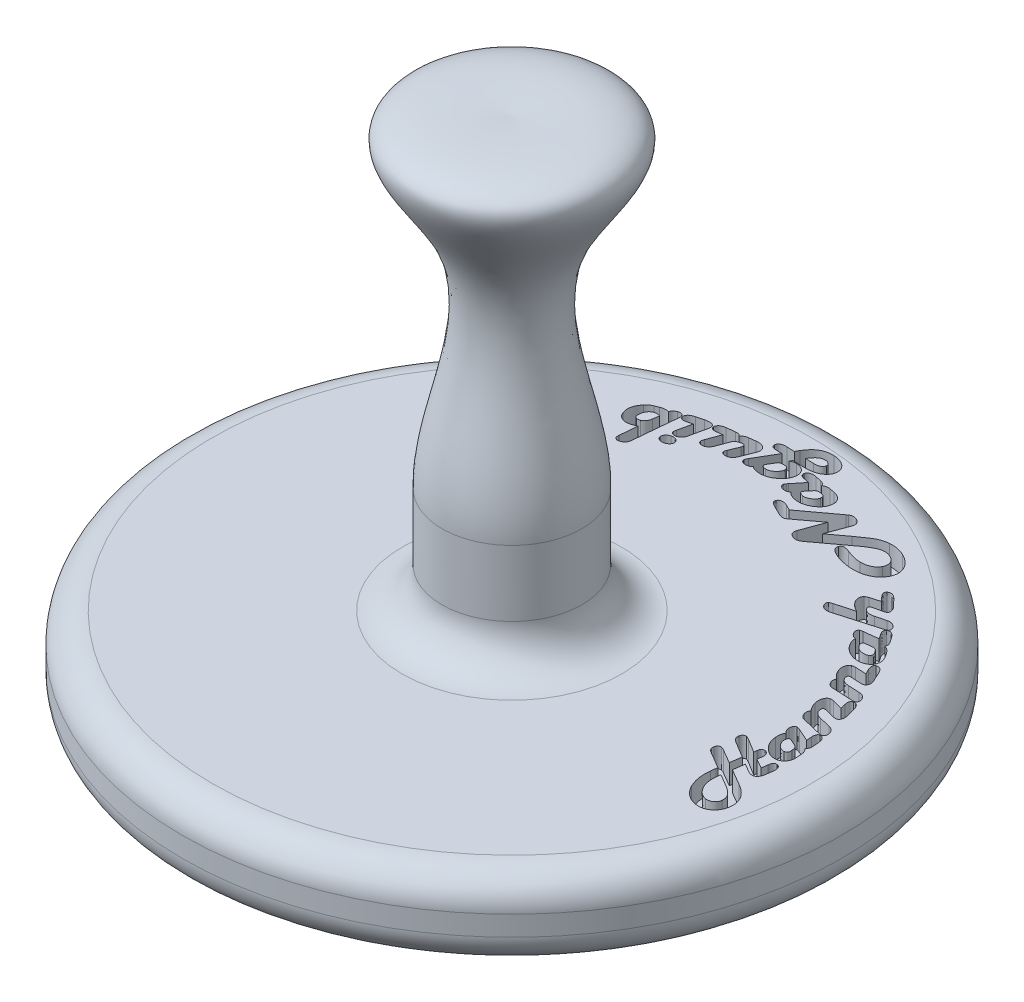
from build123d import *

# Parameters (mm, degrees)
SKETCH1_R           = 41.91
BOSS_EXTRUDE1_DEPTH = 10.16
FILLET2_R           = 3.81
FILLET8_R           = 5.08
CUT_EXTRUDE1_DEPTH  = 2.54


with BuildPart() as part:
    # Sketch1 → Boss-Extrude1 (new body)
    with BuildSketch(Plane(origin=(0, 0, 0), x_dir=(1, 0, 0), z_dir=(0, 1, 0))):
        Circle(SKETCH1_R)
    extrude(amount=BOSS_EXTRUDE1_DEPTH)

    # Sketch2 → Revolve4 (revolve)
    with BuildSketch(Plane.XY):
        with BuildLine():
            Line((-8.89, 10.16), (0, 10.16))
            Line((0, 10.16), (0, 64.77))
            add(Edge.make_bspline(
                [(-8.89, 23.611899987), (-9.074233025, 32.265824358), (2.197925067, 50.601787817), (-21.555332251, 66.428778197), (0, 64.77)],
                knots=[0, 0, 0, 0, 0.524153869, 1, 1, 1, 1], degree=3))
            Line((-8.89, 23.611899987), (-8.89, 10.16))
        make_face()
    revolve(axis=Axis((0, 0, 0), (0, 1, 0)))

    # Fillet2
    fillet2_edges = [part.edges().sort_by_distance(p)[0] for p in [
        (-41.91, 0, 0),
        (-41.91, 10.16, 0),
    ]]
    fillet(fillet2_edges, radius=FILLET2_R)

    # Fillet8
    fillet8_edges = [part.edges().sort_by_distance(p)[0] for p in [
        (8.89, 10.16, 0),
    ]]
    fillet(fillet8_edges, radius=FILLET8_R)

    # Sketch11 → Cut-Extrude1 (cut)
    # profile 1 of 13: a face of its own
    with BuildSketch(Plane(origin=(0, 10.16, 0), x_dir=(1, 0, 0), z_dir=(0, 1, 0))):
        with BuildLine():
            Line((33.020609334, 4.468921233), (32.967602057, 5.113163527))
            add(Edge.make_bspline(
                [(32.967602057, 5.113163527), (32.964150097, 5.169331612), (32.957689401, 5.27445594), (32.966140983, 5.422446699), (32.985630662, 5.55029593), (33.023474074, 5.657181297), (33.076757431, 5.743599768), (33.14759772, 5.807166963), (33.233562375, 5.850247984), (33.297377797, 5.858919734), (33.330498033, 5.863420377)],
                knots=[0, 0, 0, 0, 1.439761911, 2.694662001, 3.78945795, 4.740007024, 5.579978867, 6.360393693, 7.149043505, 8, 8, 8, 8], degree=3))
            add(Edge.make_bspline(
                [(33.330498033, 5.863420377), (33.377424074, 5.864683754), (33.468580168, 5.867137925), (33.600166326, 5.826504997), (33.71664083, 5.751473534), (33.815330367, 5.642267797), (33.899833744, 5.506648966), (33.964508269, 5.343178398), (34.010470276, 5.154236495), (34.024456299, 5.018736502), (34.031825088, 4.94734589)],
                knots=[0, 0, 0, 0, 0.867668826, 1.685488495, 2.514716047, 3.414281033, 4.397883034, 5.470550561, 6.667314016, 8, 8, 8, 8], degree=3))
            Line((34.031825088, 4.94734589), (34.092987331, 4.197089041))
            add(Edge.make_bspline(
                [(34.092987331, 4.197089041), (34.095701306, 4.156786232), (34.100948324, 4.078867493), (34.093905898, 3.965760345), (34.076016265, 3.862069697), (34.05021447, 3.766387991), (34.00826746, 3.681941285), (33.957388079, 3.60587993), (33.89606254, 3.537551072), (33.846355404, 3.501703402), (33.821155139, 3.483529538)],
                knots=[0, 0, 0, 0, 1.205368718, 2.330378798, 3.373578984, 4.345561954, 5.277450699, 6.174304705, 7.074418527, 8, 8, 8, 8], degree=3))
            add(Edge.make_bspline(
                [(33.821155139, 3.483529538), (33.877285396, 3.416694575), (33.984693857, 3.288802046), (34.104268132, 3.079750385), (34.188796263, 2.872175431), (34.20936956, 2.730323029), (34.2193893, 2.661237158)],
                knots=[0, 0, 0, 0, 1.125580217, 2.1538622, 3.100882066, 4, 4, 4, 4], degree=3))
            Line((34.2193893, 2.661237158), (34.275114899, 1.992529966))
            add(Edge.make_bspline(
                [(34.275114899, 1.992529966), (34.278678541, 1.93864768), (34.285652941, 1.833194709), (34.281637704, 1.678077789), (34.264434148, 1.530658917), (34.24017879, 1.389511602), (34.199638983, 1.2561695), (34.14978543, 1.128764465), (34.086970154, 1.009174792), (34.013666504, 0.897612192), (33.930648914, 0.795766724), (33.840098613, 0.703893531), (33.739305823, 0.62610099), (33.631995749, 0.559246424), (33.516722454, 0.504296243), (33.39356348, 0.462296173), (33.262823202, 0.431979086), (33.1725262, 0.422222272), (33.126623889, 0.417262414)],
                knots=[0, 0, 0, 0, 1.182700265, 2.314661569, 3.393271899, 4.432904085, 5.447354035, 6.440851851, 7.426483999, 8.40105822, 9.360656125, 10.301172158, 11.220497906, 12.143246801, 13.066742818, 14.011596301, 14.989198725, 16, 16, 16, 16], degree=3))
            add(Edge.make_bspline(
                [(33.126623889, 0.417262414), (33.055926941, 0.41359173), (32.915132175, 0.40628147), (32.704680926, 0.428446281), (32.498086403, 0.47325667), (32.295004728, 0.543391228), (32.096202102, 0.639447049), (31.901086394, 0.760001562), (31.709767225, 0.905476438), (31.525460338, 1.073516264), (31.351707391, 1.256722223), (31.197811225, 1.452646254), (31.061546833, 1.655088483), (30.949670832, 1.867694051), (30.855684192, 2.086876697), (30.78362882, 2.314410564), (30.732937852, 2.550781423), (30.715010943, 2.711776536), (30.705958221, 2.793075771)],
                knots=[0, 0, 0, 0, 0.909264721, 1.810823749, 2.711421999, 3.623538635, 4.566961152, 5.545309845, 6.568489844, 7.653399766, 8.749842583, 9.811806508, 10.85415174, 11.883765284, 12.896740906, 13.917628825, 14.948445218, 16, 16, 16, 16], degree=3))
            add(Edge.make_bspline(
                [(30.705958221, 2.793075771), (30.702058727, 2.854207122), (30.694524473, 2.97231965), (30.695423306, 3.144036008), (30.709067068, 3.303953743), (30.733113117, 3.452223534), (30.767859277, 3.589186237), (30.815523225, 3.713807681), (30.875322969, 3.826751338), (30.924841636, 3.893645639), (30.949248033, 3.92661601)],
                knots=[0, 0, 0, 0, 1.238188073, 2.392316208, 3.467880044, 4.479782612, 5.42618121, 6.319216684, 7.171587854, 8, 8, 8, 8], degree=3))
            add(Edge.make_bspline(
                [(30.949248033, 3.92661601), (30.920689912, 3.949637341), (30.864430445, 3.994989339), (30.788641506, 4.071983733), (30.723649955, 4.156080698), (30.668651641, 4.246909009), (30.623698396, 4.344042875), (30.588299714, 4.447347125), (30.56346358, 4.5576871), (30.555240153, 4.633719766), (30.551013872, 4.672795377)],
                knots=[0, 0, 0, 0, 1.007850277, 1.985463998, 2.962045769, 3.923257424, 4.898408538, 5.898843507, 6.920148691, 8, 8, 8, 8], degree=3))
            add(Edge.make_bspline(
                [(30.551013872, 4.672795377), (30.549538789, 4.714477971), (30.546675614, 4.795384941), (30.559320594, 4.913106411), (30.591591409, 5.020599181), (30.636881945, 5.117159392), (30.696009337, 5.198970434), (30.76607398, 5.261813748), (30.846477066, 5.304454013), (30.90482017, 5.312813931), (30.934297262, 5.317037671)],
                knots=[0, 0, 0, 0, 1.206024968, 2.340924996, 3.40688787, 4.438778255, 5.414084171, 6.305634022, 7.143943685, 8, 8, 8, 8], degree=3))
            add(Edge.make_bspline(
                [(30.934297262, 5.317037671), (30.95652277, 5.317140383), (31.003055369, 5.317355428), (31.077016306, 5.305997822), (31.156155294, 5.28047681), (31.210367318, 5.258084502), (31.238749317, 5.246361301)],
                knots=[0, 0, 0, 0, 0.844732927, 1.768581377, 2.831769832, 4, 4, 4, 4], degree=3))
            Line((31.238749317, 5.246361301), (31.365151286, 5.190635702))
            Line((31.365151286, 5.190635702), (33.020609334, 4.468921233))
        make_face()
        with BuildLine():
            Line((33.194581937, 2.340475171), (33.183708649, 2.487264555))
            add(Edge.make_bspline(
                [(33.183708649, 2.487264555), (33.180070617, 2.526820775), (33.173075565, 2.602877762), (33.148724161, 2.710262402), (33.120645573, 2.807892871), (33.079601355, 2.892703455), (33.034665048, 2.969009831), (32.978016162, 3.031586904), (32.914043597, 3.084061065), (32.865732032, 3.109218252), (32.841200088, 3.121992723)],
                knots=[0, 0, 0, 0, 1.25693327, 2.416776906, 3.483640743, 4.466061773, 5.39413648, 6.278565841, 7.125879572, 8, 8, 8, 8], degree=3))
            Line((32.841200088, 3.121992723), (32.061041697, 3.484888699))
            add(Edge.make_bspline(
                [(32.061041697, 3.484888699), (32.036728794, 3.495678267), (31.991457294, 3.515768831), (31.925432941, 3.53866676), (31.865309904, 3.550414564), (31.827304241, 3.550219369), (31.80959692, 3.550128425)],
                knots=[0, 0, 0, 0, 1.216302563, 2.264799078, 3.191547823, 4, 4, 4, 4], degree=3))
            add(Edge.make_bspline(
                [(31.80959692, 3.550128425), (31.790478273, 3.546497043), (31.751619796, 3.539116293), (31.700189395, 3.500469652), (31.655282709, 3.444378722), (31.617743525, 3.369942198), (31.586930286, 3.283730103), (31.5683353, 3.188027622), (31.55959023, 3.085829909), (31.564022327, 3.015524047), (31.566307108, 2.979280822)],
                knots=[0, 0, 0, 0, 0.68611143, 1.39451533, 2.232647793, 3.237606428, 4.352021173, 5.48998045, 6.706065189, 8, 8, 8, 8], degree=3))
            add(Edge.make_bspline(
                [(31.566307108, 2.979280822), (31.570515308, 2.942455998), (31.578906441, 2.869027455), (31.60561726, 2.760143242), (31.643572206, 2.653206852), (31.693291646, 2.54795181), (31.752753736, 2.444022238), (31.826393513, 2.343478502), (31.908534768, 2.242766889), (32.001616227, 2.146892524), (32.09846554, 2.05644191), (32.199083688, 1.979438219), (32.298569013, 1.91431187), (32.398269126, 1.864114467), (32.497265154, 1.825104682), (32.596082891, 1.798661969), (32.695543154, 1.787563673), (32.760999899, 1.790106546), (32.793629454, 1.791374144)],
                knots=[0, 0, 0, 0, 0.958468579, 1.911182266, 2.893943029, 3.890595093, 4.920289029, 5.987550671, 7.11202032, 8.281323251, 9.443136056, 10.538371178, 11.556382741, 12.515998157, 13.421812205, 14.306277462, 15.155695654, 16, 16, 16, 16], degree=3))
            add(Edge.make_bspline(
                [(32.793629454, 1.791374144), (32.828314913, 1.79551326), (32.89408289, 1.803361542), (32.984324615, 1.834632612), (33.059672595, 1.88228833), (33.118564541, 1.945744913), (33.162402498, 2.023932992), (33.188528986, 2.116836932), (33.200551216, 2.224230207), (33.196653167, 2.300140299), (33.194581937, 2.340475171)],
                knots=[0, 0, 0, 0, 1.075309393, 2.038921338, 2.918944661, 3.798967983, 4.681318681, 5.658516761, 6.755851496, 8, 8, 8, 8], degree=3))
        make_face(mode=Mode.SUBTRACT)
    # profile 2 of 13: a face of its own
    with BuildSketch(Plane(origin=(0, 10.16, 0), x_dir=(1, 0, 0), z_dir=(0, 1, 0))):
        with BuildLine():
            Line((31.693280166, 10.145356022), (31.51523008, 10.833091467))
            add(Edge.make_bspline(
                [(31.51523008, 10.833091467), (31.502492369, 10.88816907), (31.478646704, 10.991277235), (31.459273327, 11.139224579), (31.460941187, 11.26999868), (31.482048171, 11.382902451), (31.520687289, 11.479675983), (31.583401054, 11.555029258), (31.663664032, 11.614275931), (31.727743278, 11.634131718), (31.761238214, 11.64451056)],
                knots=[0, 0, 0, 0, 1.419960275, 2.658240196, 3.73990133, 4.690942045, 5.532465997, 6.325390419, 7.124662896, 8, 8, 8, 8], degree=3))
            add(Edge.make_bspline(
                [(31.761238214, 11.64451056), (31.808158629, 11.653248384), (31.899616804, 11.670280319), (32.038922285, 11.655015617), (32.168494929, 11.599992875), (32.287012598, 11.510648593), (32.394557364, 11.390991637), (32.487238346, 11.241212303), (32.564342732, 11.06270733), (32.601831131, 10.931917693), (32.621587101, 10.862993008)],
                knots=[0, 0, 0, 0, 0.876928448, 1.70932576, 2.541135606, 3.443690092, 4.425727196, 5.492237211, 6.678436901, 8, 8, 8, 8], degree=3))
            Line((32.621587101, 10.862993008), (32.9314758, 9.664213043))
            add(Edge.make_bspline(
                [(32.9314758, 9.664213043), (32.944074997, 9.608291003), (32.968460508, 9.500054936), (32.975746705, 9.337778811), (32.96236589, 9.183227002), (32.921059978, 9.040677556), (32.86229424, 8.913408773), (32.780372706, 8.811163074), (32.679029584, 8.734613754), (32.60040265, 8.708439536), (32.560424858, 8.695131279)],
                knots=[0, 0, 0, 0, 1.194036763, 2.311035898, 3.374965089, 4.41643784, 5.39316604, 6.280522432, 7.125733225, 8, 8, 8, 8], degree=3))
            add(Edge.make_bspline(
                [(32.560424858, 8.695131279), (32.531042774, 8.689869277), (32.464453454, 8.677943877), (32.35048321, 8.688608004), (32.212573329, 8.706035137), (32.113970247, 8.730650958), (32.060253625, 8.744061073)],
                knots=[0, 0, 0, 0, 0.70425475, 1.596069422, 2.690395614, 4, 4, 4, 4], degree=3))
            Line((32.060253625, 8.744061073), (30.94845996, 9.018611587))
            add(Edge.make_bspline(
                [(30.94845996, 9.018611587), (30.92088253, 9.024763154), (30.869605183, 9.03620135), (30.797131237, 9.048383874), (30.73396352, 9.050157415), (30.695625078, 9.045307676), (30.67798693, 9.043076484)],
                knots=[0, 0, 0, 0, 1.240045695, 2.305735231, 3.220529251, 4, 4, 4, 4], degree=3))
            add(Edge.make_bspline(
                [(30.67798693, 9.043076484), (30.6606852, 9.038319304), (30.626087365, 9.028806489), (30.582310075, 8.992865702), (30.546618847, 8.943866961), (30.52035073, 8.881494489), (30.504773903, 8.809659234), (30.499144055, 8.731331148), (30.50667922, 8.647227761), (30.519203308, 8.590353583), (30.525760902, 8.560574344)],
                knots=[0, 0, 0, 0, 0.761249552, 1.522251584, 2.368581984, 3.342234972, 4.397060437, 5.506210927, 6.694255593, 8, 8, 8, 8], degree=3))
            add(Edge.make_bspline(
                [(30.525760902, 8.560574344), (30.539967998, 8.51236128), (30.567955365, 8.417383624), (30.63835386, 8.28686501), (30.726034815, 8.168478652), (30.833686987, 8.063127005), (30.960000235, 7.969569947), (31.107209404, 7.891703789), (31.272273952, 7.824104926), (31.391106059, 7.792646522), (31.452708676, 7.776338471)],
                knots=[0, 0, 0, 0, 0.93993939, 1.851640058, 2.762034535, 3.692837041, 4.664394408, 5.697996351, 6.806640288, 8, 8, 8, 8], degree=3))
            Line((31.452708676, 7.776338471), (32.894778454, 7.42159746))
            add(Edge.make_bspline(
                [(32.894778454, 7.42159746), (32.94726099, 7.407382074), (33.049164287, 7.379780613), (33.191678275, 7.319844315), (33.317936866, 7.244746664), (33.428097256, 7.155280833), (33.523348955, 7.052134876), (33.602368184, 6.934291517), (33.666086333, 6.801951831), (33.694375576, 6.706704734), (33.708915868, 6.657749001)],
                knots=[0, 0, 0, 0, 1.105537498, 2.146579103, 3.134722674, 4.084984764, 5.024498413, 5.980778407, 6.962147141, 8, 8, 8, 8], degree=3))
            add(Edge.make_bspline(
                [(33.708915868, 6.657749001), (33.71751516, 6.617593819), (33.734201489, 6.539675484), (33.743783283, 6.422932796), (33.731790538, 6.311627932), (33.706868692, 6.208559981), (33.669394956, 6.116548295), (33.614875193, 6.044269891), (33.549611131, 5.988450204), (33.497259818, 5.970727305), (33.4710627, 5.961858591)],
                knots=[0, 0, 0, 0, 1.217228951, 2.361948008, 3.455384681, 4.52081737, 5.501580879, 6.374781531, 7.18672451, 8, 8, 8, 8], degree=3))
            add(Edge.make_bspline(
                [(33.4710627, 5.961858591), (33.449391978, 5.957551592), (33.403224025, 5.948375832), (33.32811633, 5.948563985), (33.244205511, 5.956409168), (33.186424879, 5.969733014), (33.155737358, 5.976809361)],
                knots=[0, 0, 0, 0, 0.830440382, 1.76919497, 2.815210682, 4, 4, 4, 4], degree=3))
            Line((33.155737358, 5.976809361), (33.021180423, 6.008070063))
            Line((33.021180423, 6.008070063), (30.555662443, 6.602023402))
            add(Edge.make_bspline(
                [(30.555662443, 6.602023402), (30.516793319, 6.612739206), (30.441335765, 6.633542051), (30.335634241, 6.682146389), (30.241671762, 6.745117159), (30.157953973, 6.820662103), (30.084267263, 6.908965944), (30.024327444, 7.012171155), (29.970972316, 7.126717414), (29.947830809, 7.210046571), (29.935885046, 7.253061501)],
                knots=[0, 0, 0, 0, 1.017676582, 1.975639699, 2.925081311, 3.865436485, 4.81680898, 5.818190258, 6.873738806, 8, 8, 8, 8], degree=3))
            add(Edge.make_bspline(
                [(29.935885046, 7.253061501), (29.927365369, 7.288701674), (29.910998372, 7.357169366), (29.900340746, 7.459388791), (29.899962972, 7.555998292), (29.910447348, 7.647422323), (29.932695906, 7.733292315), (29.9650402, 7.813560366), (30.009278695, 7.888951013), (30.047073765, 7.933175426), (30.066364498, 7.955747717)],
                knots=[0, 0, 0, 0, 1.1761484, 2.259477511, 3.29286662, 4.274963557, 5.206923959, 6.13398437, 7.047579219, 8, 8, 8, 8], degree=3))
            add(Edge.make_bspline(
                [(30.066364498, 7.955747717), (29.995028688, 8.045836734), (29.856728046, 8.220494719), (29.687952677, 8.49914768), (29.55363741, 8.778117207), (29.495449479, 8.970619666), (29.466974515, 9.06482306)],
                knots=[0, 0, 0, 0, 1.084567248, 2.102679504, 3.071523392, 4, 4, 4, 4], degree=3))
            add(Edge.make_bspline(
                [(29.466974515, 9.06482306), (29.446856736, 9.152318672), (29.40808721, 9.320933871), (29.3914979, 9.570816838), (29.404193865, 9.80459887), (29.446763488, 9.985817001), (29.495870908, 10.11833804), (29.539413725, 10.207267103), (29.589453655, 10.286583393), (29.646797635, 10.355481969), (29.711536946, 10.412751842), (29.781854311, 10.461459189), (29.859201011, 10.499846256), (29.91475431, 10.516293787), (29.942680851, 10.52456193)],
                knots=[0, 0, 0, 0, 1.901175166, 3.663806881, 5.290936471, 6.850013585, 7.588804195, 8.284878678, 8.945854661, 9.573227951, 10.178815182, 10.773093534, 11.3832364, 12, 12, 12, 12], degree=3))
            add(Edge.make_bspline(
                [(29.942680851, 10.52456193), (29.976073438, 10.531663785), (30.045468821, 10.546422629), (30.156433478, 10.544946264), (30.27608968, 10.533856715), (30.356970483, 10.51348951), (30.399358933, 10.502815354)],
                knots=[0, 0, 0, 0, 0.884125995, 1.837361697, 2.866592806, 4, 4, 4, 4], degree=3))
            Line((30.399358933, 10.502815354), (31.693280166, 10.145356022))
        make_face()
    # profile 3 of 13: a face of its own
    with BuildSketch(Plane(origin=(0, 10.16, 0), x_dir=(1, 0, 0), z_dir=(0, 1, 0))):
        with BuildLine():
            Line((29.453930517, 15.545526926), (29.160351749, 16.187050898))
            add(Edge.make_bspline(
                [(29.160351749, 16.187050898), (29.135862637, 16.243759688), (29.090066634, 16.349808277), (29.039502189, 16.504147953), (29.012622914, 16.642561434), (29.006361943, 16.764927346), (29.024523653, 16.872153679), (29.067565849, 16.962309739), (29.134371182, 17.035506989), (29.191833428, 17.066651248), (29.221513993, 17.08273797)],
                knots=[0, 0, 0, 0, 1.476465141, 2.761071926, 3.874272508, 4.838849585, 5.675916627, 6.446193431, 7.197423359, 8, 8, 8, 8], degree=3))
            add(Edge.make_bspline(
                [(29.221513993, 17.08273797), (29.265283811, 17.099472735), (29.350804879, 17.132170494), (29.490233484, 17.135009456), (29.627489936, 17.099217804), (29.760662117, 17.023481042), (29.889198739, 16.915513145), (30.009591248, 16.773163619), (30.122198309, 16.599800866), (30.185708472, 16.469188979), (30.219138136, 16.400439169)],
                knots=[0, 0, 0, 0, 0.829672159, 1.621081619, 2.437454097, 3.329673835, 4.326993528, 5.414385573, 6.639017447, 8, 8, 8, 8], degree=3))
            Line((30.219138136, 16.400439169), (30.731541818, 15.2818497))
            add(Edge.make_bspline(
                [(30.731541818, 15.2818497), (30.754726355, 15.226193528), (30.79964775, 15.118356441), (30.841467671, 14.952801184), (30.855011374, 14.791322737), (30.845236809, 14.637834808), (30.810937475, 14.498400429), (30.754630819, 14.377767501), (30.668204887, 14.284015901), (30.596444425, 14.243485014), (30.560287537, 14.223063313)],
                knots=[0, 0, 0, 0, 1.220546549, 2.364880273, 3.442783078, 4.491805583, 5.466938907, 6.337238754, 7.162208948, 8, 8, 8, 8], degree=3))
            add(Edge.make_bspline(
                [(30.560287537, 14.223063313), (30.532445234, 14.21301175), (30.469607055, 14.190326059), (30.35763176, 14.17763498), (30.22104667, 14.170312441), (30.121297563, 14.174544452), (30.066912109, 14.17685184)],
                knots=[0, 0, 0, 0, 0.709665858, 1.601667421, 2.692375211, 4, 4, 4, 4], degree=3))
            Line((30.066912109, 14.17685184), (28.942885996, 14.228499957))
            add(Edge.make_bspline(
                [(28.942885996, 14.228499957), (28.915237534, 14.230035287), (28.863541106, 14.232906011), (28.791457524, 14.227693981), (28.729307809, 14.221767931), (28.693120053, 14.209618274), (28.676490448, 14.204035059)],
                knots=[0, 0, 0, 0, 1.232261171, 2.304052205, 3.220649606, 4, 4, 4, 4], degree=3))
            add(Edge.make_bspline(
                [(28.676490448, 14.204035059), (28.660534494, 14.195802529), (28.628844601, 14.179452019), (28.590046308, 14.139113033), (28.564989017, 14.085160126), (28.548865002, 14.021577426), (28.545331113, 13.950087446), (28.554351708, 13.874744175), (28.573013133, 13.795627369), (28.595427383, 13.744334635), (28.607173239, 13.717455436)],
                knots=[0, 0, 0, 0, 0.786830874, 1.562713559, 2.410165736, 3.377747244, 4.436628086, 5.540219368, 6.710988354, 8, 8, 8, 8], degree=3))
            add(Edge.make_bspline(
                [(28.607173239, 13.717455436), (28.628879896, 13.674473609), (28.67187433, 13.589339389), (28.760579563, 13.477220606), (28.865464936, 13.380934205), (28.986564239, 13.299480349), (29.125619602, 13.236298273), (29.280215649, 13.187235543), (29.451403927, 13.154897355), (29.571137762, 13.145864025), (29.633339763, 13.14117119)],
                knots=[0, 0, 0, 0, 0.928111098, 1.838312154, 2.742436132, 3.669515422, 4.644302123, 5.682054108, 6.7958218, 8, 8, 8, 8], degree=3))
            Line((29.633339763, 13.14117119), (31.097156116, 13.065058176))
            add(Edge.make_bspline(
                [(31.097156116, 13.065058176), (31.150292587, 13.060737773), (31.253316337, 13.052361153), (31.401384084, 13.02179766), (31.535794873, 12.971913033), (31.658468054, 12.907954583), (31.768360933, 12.827129847), (31.864397926, 12.729275227), (31.947174699, 12.615020087), (31.989939176, 12.529774705), (32.011871441, 12.486055607)],
                knots=[0, 0, 0, 0, 1.116894598, 2.165493235, 3.156935094, 4.112716824, 5.056678693, 6.003502215, 6.976072608, 8, 8, 8, 8], degree=3))
            add(Edge.make_bspline(
                [(32.011871441, 12.486055607), (32.026821867, 12.449237533), (32.055629297, 12.378294126), (32.083119955, 12.268668895), (32.089091933, 12.16110759), (32.080519951, 12.058161298), (32.055153319, 11.965092857), (32.016149756, 11.883889362), (31.957283446, 11.820607833), (31.908505645, 11.793066305), (31.884110311, 11.779291909)],
                knots=[0, 0, 0, 0, 1.202814496, 2.317659463, 3.403764712, 4.450952774, 5.432918895, 6.310401208, 7.154977761, 8, 8, 8, 8], degree=3))
            add(Edge.make_bspline(
                [(31.884110311, 11.779291909), (31.86350608, 11.770777807), (31.819828293, 11.752729227), (31.744926668, 11.74138229), (31.660912151, 11.7338391), (31.601428633, 11.73601404), (31.57014413, 11.737157919)],
                knots=[0, 0, 0, 0, 0.834142631, 1.768253543, 2.826244954, 4, 4, 4, 4], degree=3))
            Line((31.57014413, 11.737157919), (31.431509712, 11.743953724))
            Line((31.431509712, 11.743953724), (28.887160397, 11.86627821))
            add(Edge.make_bspline(
                [(28.887160397, 11.86627821), (28.847100995, 11.869067834), (28.768708808, 11.874526847), (28.656782868, 11.904276773), (28.552770968, 11.946784582), (28.456964729, 12.003948364), (28.370365119, 12.077441324), (28.292564508, 12.165528081), (28.222543086, 12.268258346), (28.184903606, 12.344635478), (28.165445927, 12.384118535)],
                knots=[0, 0, 0, 0, 1.02311558, 2.002133457, 2.940761203, 3.884930816, 4.837142063, 5.828381164, 6.877384519, 8, 8, 8, 8], degree=3))
            add(Edge.make_bspline(
                [(28.165445927, 12.384118535), (28.151115628, 12.41691665), (28.123341726, 12.48048347), (28.094986987, 12.577669328), (28.077388167, 12.671571982), (28.075980622, 12.762506019), (28.081181055, 12.850516885), (28.102417326, 12.935143896), (28.135080982, 13.016832198), (28.166024891, 13.066826016), (28.181755859, 13.092241395)],
                knots=[0, 0, 0, 0, 1.155184871, 2.23889178, 3.263981393, 4.230445148, 5.170046503, 6.103700953, 7.035977654, 8, 8, 8, 8], degree=3))
            add(Edge.make_bspline(
                [(28.181755859, 13.092241395), (28.096808595, 13.16439751), (27.931893237, 13.304480321), (27.717374195, 13.536834197), (27.539917982, 13.778988453), (27.451559719, 13.952225319), (27.408393273, 14.036858261)],
                knots=[0, 0, 0, 0, 1.085414857, 2.107208307, 3.075297693, 4, 4, 4, 4], degree=3))
            add(Edge.make_bspline(
                [(27.408393273, 14.036858261), (27.374381571, 14.117140274), (27.309210408, 14.270971797), (27.251418762, 14.507016986), (27.229669249, 14.73337885), (27.242618101, 14.915158216), (27.271967367, 15.051101797), (27.301342778, 15.144670361), (27.339346347, 15.230522721), (27.387750617, 15.306291649), (27.44159414, 15.376102598), (27.50723098, 15.433662058), (27.57758015, 15.48748636), (27.631206652, 15.513347008), (27.65847889, 15.526498672)],
                knots=[0, 0, 0, 0, 1.869949698, 3.583084224, 5.195016438, 6.736651788, 7.473246659, 8.177855919, 8.839725277, 9.482218637, 10.105189204, 10.724960733, 11.351567346, 12, 12, 12, 12], degree=3))
            add(Edge.make_bspline(
                [(27.65847889, 15.526498672), (27.690785981, 15.539695058), (27.757544542, 15.566963737), (27.868148336, 15.590284713), (27.988917322, 15.602279685), (28.072993207, 15.601602881), (28.116516133, 15.601252525)],
                knots=[0, 0, 0, 0, 0.893217782, 1.845722801, 2.884811674, 4, 4, 4, 4], degree=3))
            Line((28.116516133, 15.601252525), (29.453930517, 15.545526926))
        make_face()
    # profile 4 of 13: a face of its own
    with BuildSketch(Plane(origin=(0, 10.16, 0), x_dir=(1, 0, 0), z_dir=(0, 1, 0))):
        with BuildLine():
            Line((26.456855697, 20.242321771), (26.088523077, 20.780549511))
            add(Edge.make_bspline(
                [(26.088523077, 20.780549511), (26.055919284, 20.830294617), (25.995091531, 20.923102315), (25.922714959, 21.061421525), (25.874989309, 21.188251256), (25.851353283, 21.30402002), (25.852366655, 21.409240742), (25.880915298, 21.502334042), (25.932031216, 21.585667625), (25.984107085, 21.624753188), (26.011050902, 21.644975881)],
                knots=[0, 0, 0, 0, 1.466442338, 2.735890034, 3.842410896, 4.797961956, 5.636362269, 6.407011466, 7.175794977, 8, 8, 8, 8], degree=3))
            add(Edge.make_bspline(
                [(26.011050902, 21.644975881), (26.051664057, 21.66914014), (26.130738189, 21.716188143), (26.267214622, 21.745442431), (26.408258058, 21.734105466), (26.551848345, 21.6855174), (26.696370715, 21.603770589), (26.838759103, 21.488858761), (26.975901014, 21.340099474), (27.058825095, 21.22549392), (27.102457152, 21.165192062)],
                knots=[0, 0, 0, 0, 0.847877227, 1.650823641, 2.469904676, 3.371697799, 4.362929293, 5.45013923, 6.658343004, 8, 8, 8, 8], degree=3))
            Line((27.102457152, 21.165192062), (27.530592854, 20.539978021))
            add(Edge.make_bspline(
                [(27.530592854, 20.539978021), (27.553173346, 20.506030608), (27.59676212, 20.440499437), (27.646213896, 20.338108575), (27.684671429, 20.239444521), (27.706725874, 20.142353978), (27.713659031, 20.047483403), (27.706712911, 19.955505826), (27.687029794, 19.865488405), (27.661660501, 19.809739508), (27.648839858, 19.781566206)],
                knots=[0, 0, 0, 0, 1.209757721, 2.335283733, 3.370179621, 4.349686993, 5.280749995, 6.184968727, 7.082754518, 8, 8, 8, 8], degree=3))
            add(Edge.make_bspline(
                [(27.648839858, 19.781566206), (27.691164649, 19.766196354), (27.773536846, 19.736283661), (27.891213737, 19.684275546), (28.000051201, 19.627574853), (28.099743225, 19.565032364), (28.190057534, 19.496578084), (28.271425528, 19.423387443), (28.344742515, 19.345517365), (28.38648958, 19.289077053), (28.407251673, 19.261007559)],
                knots=[0, 0, 0, 0, 1.154785773, 2.247435585, 3.297476837, 4.300214239, 5.262469441, 6.200561373, 7.10508413, 8, 8, 8, 8], degree=3))
            Line((28.407251673, 19.261007559), (28.787816741, 18.703751566))
            add(Edge.make_bspline(
                [(28.787816741, 18.703751566), (28.817406342, 18.658363068), (28.87545568, 18.569319207), (28.950485726, 18.432543108), (29.010314654, 18.295286164), (29.059032708, 18.15948549), (29.091627878, 18.022670915), (29.110231711, 17.886565248), (29.11823502, 17.750941086), (29.109087577, 17.61712424), (29.089610083, 17.486690691), (29.055609162, 17.362016737), (29.007167856, 17.245073609), (28.949014393, 17.133464586), (28.875689636, 17.029516657), (28.790285431, 16.931807127), (28.691640447, 16.841277339), (28.618486225, 16.78842931), (28.581224276, 16.761510555)],
                knots=[0, 0, 0, 0, 1.184309947, 2.323397687, 3.405509962, 4.454897961, 5.473497886, 6.473631057, 7.455449754, 8.437817861, 9.400209668, 10.334935541, 11.254583774, 12.16290804, 13.080634108, 14.02823323, 14.995657784, 16, 16, 16, 16], degree=3))
            add(Edge.make_bspline(
                [(28.581224276, 16.761510555), (28.52139218, 16.723263186), (28.402896158, 16.647515192), (28.209820925, 16.561318416), (28.007621956, 16.500975471), (27.796835169, 16.460481441), (27.576464782, 16.446118831), (27.347441897, 16.456406467), (27.109198598, 16.489927572), (26.86561198, 16.545159847), (26.6236715, 16.620184093), (26.391884398, 16.713635935), (26.174879592, 16.82590214), (25.970987962, 16.954326077), (25.780100591, 17.099568282), (25.604635538, 17.263592689), (25.442395125, 17.444045569), (25.347083981, 17.575647845), (25.29885056, 17.642246857)],
                knots=[0, 0, 0, 0, 0.910632949, 1.803486592, 2.70313325, 3.614508755, 4.553035955, 5.530938651, 6.552469198, 7.63747114, 8.733807877, 9.800829458, 10.841273224, 11.865861931, 12.89064869, 13.915303418, 14.945012672, 16, 16, 16, 16], degree=3))
            add(Edge.make_bspline(
                [(25.29885056, 17.642246857), (25.264609614, 17.693444374), (25.198337216, 17.792535747), (25.113751617, 17.943813741), (25.045831585, 18.090835796), (24.991739844, 18.232191495), (24.954693185, 18.369324361), (24.932390471, 18.5012554), (24.925594496, 18.629294662), (24.935267548, 18.711962724), (24.940032067, 18.75268136)],
                knots=[0, 0, 0, 0, 1.237712468, 2.395558097, 3.479374613, 4.490878575, 5.434162489, 6.329452492, 7.177162068, 8, 8, 8, 8], degree=3))
            add(Edge.make_bspline(
                [(24.940032067, 18.75268136), (24.904487591, 18.757612066), (24.833810301, 18.767416373), (24.732864456, 18.798750846), (24.635431922, 18.836269031), (24.545131853, 18.887003904), (24.45899317, 18.947546658), (24.38016786, 19.020018284), (24.303317195, 19.100431811), (24.259717068, 19.16164238), (24.237345851, 19.193049511)],
                knots=[0, 0, 0, 0, 1.003881239, 1.996135989, 2.953253272, 3.924909877, 4.890075941, 5.896922862, 6.920911537, 8, 8, 8, 8], degree=3))
            add(Edge.make_bspline(
                [(24.237345851, 19.193049511), (24.214812048, 19.227722138), (24.171416418, 19.294494735), (24.128436117, 19.402217684), (24.100878067, 19.508635665), (24.094216253, 19.613745728), (24.105650488, 19.71262596), (24.135302419, 19.801171961), (24.185413245, 19.875847695), (24.230864239, 19.91262954), (24.253655782, 19.931073912)],
                knots=[0, 0, 0, 0, 1.210898249, 2.331949656, 3.386523854, 4.425814171, 5.403840285, 6.291155986, 7.143094789, 8, 8, 8, 8], degree=3))
            add(Edge.make_bspline(
                [(24.253655782, 19.931073912), (24.27240825, 19.942063343), (24.312107404, 19.965328076), (24.381581429, 19.990315019), (24.461602708, 20.010945868), (24.519473176, 20.018276656), (24.549952871, 20.022137696)],
                knots=[0, 0, 0, 0, 0.832813979, 1.763075179, 2.821838009, 4, 4, 4, 4], degree=3))
            Line((24.549952871, 20.022137696), (24.685868967, 20.037088466))
            Line((24.685868967, 20.037088466), (26.456855697, 20.242321771))
        make_face()
        with BuildLine():
            Line((27.670586433, 18.469975881), (27.587677615, 18.592300367))
            add(Edge.make_bspline(
                [(27.587677615, 18.592300367), (27.565946075, 18.622107441), (27.524172111, 18.679404793), (27.456372056, 18.756385785), (27.384977463, 18.819583805), (27.311774704, 18.870407099), (27.236277331, 18.907866784), (27.158744673, 18.93164441), (27.079076637, 18.941389008), (27.025892016, 18.93791444), (26.999160919, 18.93616809)],
                knots=[0, 0, 0, 0, 1.231918847, 2.368085075, 3.418787907, 4.40946426, 5.336728513, 6.222428568, 7.10657567, 8, 8, 8, 8], degree=3))
            Line((26.999160919, 18.93616809), (26.155121964, 18.83694934))
            add(Edge.make_bspline(
                [(26.155121964, 18.83694934), (26.128721689, 18.833971418), (26.079574004, 18.828427613), (26.012121118, 18.811143344), (25.953974616, 18.792467014), (25.921523758, 18.772747622), (25.906395508, 18.763554648)],
                knots=[0, 0, 0, 0, 1.216327119, 2.26435751, 3.190861672, 4, 4, 4, 4], degree=3))
            add(Edge.make_bspline(
                [(25.906395508, 18.763554648), (25.891259541, 18.75087292), (25.860432525, 18.725044386), (25.833020024, 18.665995019), (25.822402977, 18.595059477), (25.824057938, 18.513180687), (25.840754502, 18.425417191), (25.870277921, 18.335185061), (25.911730916, 18.244212722), (25.94953275, 18.186806059), (25.968916912, 18.15736886)],
                knots=[0, 0, 0, 0, 0.707826493, 1.441611148, 2.291345183, 3.29236301, 4.393039992, 5.5138345, 6.72513495, 8, 8, 8, 8], degree=3))
            add(Edge.make_bspline(
                [(25.968916912, 18.15736886), (25.99062632, 18.128432349), (26.034275661, 18.07025206), (26.10907861, 17.989708966), (26.193745071, 17.917625553), (26.287663445, 17.853536871), (26.389325793, 17.794542482), (26.501732465, 17.744666243), (26.62267855, 17.701479476), (26.749740542, 17.665194015), (26.878286807, 17.638512129), (27.002744577, 17.621260847), (27.121048787, 17.617888723), (27.232707805, 17.621995014), (27.338072767, 17.639979988), (27.436894018, 17.668912826), (27.529926428, 17.707278946), (27.585863306, 17.742895667), (27.613501673, 17.76049386)],
                knots=[0, 0, 0, 0, 0.944062839, 1.898150361, 2.862956255, 3.84072668, 4.86333126, 5.927439869, 7.046159757, 8.214374176, 9.374295182, 10.471739049, 11.489612338, 12.460706034, 13.384393173, 14.271533762, 15.14596622, 16, 16, 16, 16], degree=3))
            add(Edge.make_bspline(
                [(27.613501673, 17.76049386), (27.64146133, 17.781746713), (27.694515186, 17.822074312), (27.759027136, 17.895089284), (27.796832863, 17.97804744), (27.81793339, 18.065682311), (27.811608263, 18.159816587), (27.786217243, 18.259126463), (27.738667705, 18.364823227), (27.694255218, 18.433419049), (27.670586433, 18.469975881)],
                knots=[0, 0, 0, 0, 1.035757567, 1.965365078, 2.838549178, 3.701435936, 4.598154224, 5.590454854, 6.715879, 8, 8, 8, 8], degree=3))
        make_face(mode=Mode.SUBTRACT)
    # profile 5 of 13: a face of its own
    with BuildSketch(Plane(origin=(0, 10.16, 0), x_dir=(1, 0, 0), z_dir=(0, 1, 0))):
        with BuildLine():
            add(Edge.make_bspline(
                [(21.986025926, 21.835053386), (21.89740563, 21.884608884), (21.729126029, 21.978708993), (21.501444008, 22.13049373), (21.305391804, 22.274733618), (21.195868101, 22.379885954), (21.144705292, 22.429006725)],
                knots=[0, 0, 0, 0, 1.178729173, 2.238269171, 3.177026582, 4, 4, 4, 4], degree=3))
            add(Edge.make_bspline(
                [(21.144705292, 22.429006725), (21.083855962, 22.494940163), (20.967104033, 22.621446996), (20.829499607, 22.829413757), (20.725366476, 23.036755814), (20.674191052, 23.213692786), (20.650664683, 23.350798049), (20.647307765, 23.448407051), (20.651698506, 23.540613452), (20.668533462, 23.627819403), (20.695055454, 23.709661255), (20.734689814, 23.785092522), (20.781600332, 23.857471754), (20.822256422, 23.898898496), (20.84297156, 23.920006297)],
                knots=[0, 0, 0, 0, 1.913659597, 3.671748713, 5.307818662, 6.851217216, 7.586274228, 8.274001813, 8.933220858, 9.553875647, 10.165945164, 10.763222784, 11.369835863, 12, 12, 12, 12], degree=3))
            add(Edge.make_bspline(
                [(20.84297156, 23.920006297), (20.870901286, 23.944365385), (20.928621955, 23.994706831), (21.030355871, 24.056902877), (21.147292912, 24.108497253), (21.231387656, 24.134699196), (21.275184745, 24.148345338)],
                knots=[0, 0, 0, 0, 0.899848399, 1.859661968, 2.885298042, 4, 4, 4, 4], degree=3))
            Line((21.275184745, 24.148345338), (22.505225412, 24.50580467))
            Line((22.505225412, 24.50580467), (22.032237399, 24.993743455))
            add(Edge.make_bspline(
                [(22.032237399, 24.993743455), (21.990786922, 25.038896746), (21.913242037, 25.123368794), (21.814373983, 25.250829865), (21.744976896, 25.373196992), (21.700859428, 25.487598267), (21.683607392, 25.595643845), (21.696101186, 25.696431795), (21.736674449, 25.790107173), (21.782750525, 25.840317306), (21.806616679, 25.86632479)],
                knots=[0, 0, 0, 0, 1.455401096, 2.722740918, 3.820987816, 4.7842649, 5.621067411, 6.391021933, 7.166593083, 8, 8, 8, 8], degree=3))
            add(Edge.make_bspline(
                [(21.806616679, 25.86632479), (21.843610244, 25.898066762), (21.91533611, 25.959610452), (22.048081039, 26.012931603), (22.191760536, 26.02752018), (22.344191106, 26.003122465), (22.503193373, 25.945856392), (22.666243012, 25.853611319), (22.832511771, 25.727348032), (22.936805615, 25.624345924), (22.991805036, 25.570027701)],
                knots=[0, 0, 0, 0, 0.852115885, 1.652145483, 2.469117102, 3.362184938, 4.341936182, 5.425566709, 6.642371077, 8, 8, 8, 8], degree=3))
            Line((22.991805036, 25.570027701), (23.81953406, 24.716474619))
            add(Edge.make_bspline(
                [(23.81953406, 24.716474619), (23.86190821, 24.670311692), (23.943747546, 24.581154901), (24.043981767, 24.43614644), (24.118596924, 24.287883219), (24.167273962, 24.140771596), (24.190484565, 24.001079791), (24.186468866, 23.874381289), (24.147661873, 23.762891258), (24.099205496, 23.706285984), (24.07505632, 23.678075647)],
                knots=[0, 0, 0, 0, 1.282387327, 2.47673939, 3.597248535, 4.671297827, 5.63857627, 6.484307965, 7.244625431, 8, 8, 8, 8], degree=3))
            add(Edge.make_bspline(
                [(24.07505632, 23.678075647), (24.053867369, 23.660485694), (24.007813422, 23.622254131), (23.919385609, 23.578805067), (23.811788635, 23.53965132), (23.73189093, 23.520049174), (23.689054608, 23.509539688)],
                knots=[0, 0, 0, 0, 0.77414433, 1.68259403, 2.757546927, 4, 4, 4, 4], degree=3))
            Line((23.689054608, 23.509539688), (22.584056748, 23.260813232))
            add(Edge.make_bspline(
                [(22.584056748, 23.260813232), (22.552234073, 23.252581307), (22.493494357, 23.23738645), (22.414694092, 23.211351789), (22.352895335, 23.182026027), (22.320982199, 23.157536247), (22.306787912, 23.146643712)],
                knots=[0, 0, 0, 0, 1.304042713, 2.407060391, 3.291494227, 4, 4, 4, 4], degree=3))
            add(Edge.make_bspline(
                [(22.306787912, 23.146643712), (22.293544116, 23.132394635), (22.268186525, 23.105112259), (22.246942311, 23.052878478), (22.24180695, 22.996401086), (22.252346267, 22.935512308), (22.278015978, 22.87089613), (22.31875335, 22.802096779), (22.375233259, 22.728990347), (22.42008389, 22.680534333), (22.444063169, 22.654627444)],
                knots=[0, 0, 0, 0, 0.811727978, 1.554196733, 2.31950121, 3.167692544, 4.125837396, 5.226240516, 6.517016355, 8, 8, 8, 8], degree=3))
            add(Edge.make_bspline(
                [(22.444063169, 22.654627444), (22.480185357, 22.620727272), (22.551571696, 22.553732183), (22.677118695, 22.475493736), (22.813653856, 22.416783739), (22.963073474, 22.378472362), (23.124129095, 22.361397262), (23.297293309, 22.365501555), (23.482351215, 22.386627317), (23.607756422, 22.416331542), (23.672744676, 22.431725047)],
                knots=[0, 0, 0, 0, 0.904610041, 1.787732215, 2.690098459, 3.614992073, 4.599102237, 5.643743653, 6.778926417, 8, 8, 8, 8], degree=3))
            Line((23.672744676, 22.431725047), (24.957151782, 22.756564516))
            add(Edge.make_bspline(
                [(24.957151782, 22.756564516), (25.00677523, 22.767876804), (25.103422377, 22.789908734), (25.248792298, 22.799777448), (25.388451115, 22.79468563), (25.522256633, 22.765968855), (25.650398559, 22.72131101), (25.773291373, 22.658294812), (25.88819745, 22.57366712), (25.958215215, 22.506837915), (25.994191594, 22.472499876)],
                knots=[0, 0, 0, 0, 1.077372991, 2.098302956, 3.079097549, 4.030291537, 4.987093344, 5.949278586, 6.946302719, 8, 8, 8, 8], degree=3))
            add(Edge.make_bspline(
                [(25.994191594, 22.472499876), (26.020603756, 22.443861947), (26.072044501, 22.388086262), (26.129993865, 22.292950666), (26.173556523, 22.19531949), (26.198678265, 22.096074359), (26.208647977, 22.000194613), (26.196401061, 21.91220913), (26.165270496, 21.833729399), (26.129163374, 21.79295399), (26.111079436, 21.772531982)],
                knots=[0, 0, 0, 0, 1.193074072, 2.323649985, 3.400975621, 4.46338977, 5.454227602, 6.339193449, 7.168199519, 8, 8, 8, 8], degree=3))
            add(Edge.make_bspline(
                [(26.111079436, 21.772531982), (26.094244888, 21.757972914), (26.05892434, 21.72742655), (25.994868543, 21.68972636), (25.919681429, 21.65560937), (25.864385089, 21.637846025), (25.835169762, 21.62846092)],
                knots=[0, 0, 0, 0, 0.849252453, 1.781815641, 2.828042107, 4, 4, 4, 4], degree=3))
            Line((25.835169762, 21.62846092), (25.701971988, 21.590404414))
            Line((25.701971988, 21.590404414), (20.429786628, 20.061348335))
            add(Edge.make_bspline(
                [(20.429786628, 20.061348335), (20.374285392, 20.047610969), (20.267322288, 20.021136039), (20.10833096, 19.999705638), (19.957976999, 19.999504003), (19.81607936, 20.018266354), (19.682708413, 20.056631945), (19.557350043, 20.114354489), (19.440934586, 20.192160881), (19.37283491, 20.256921975), (19.338380378, 20.289687376)],
                knots=[0, 0, 0, 0, 1.166146677, 2.247421446, 3.264301744, 4.225226835, 5.15854165, 6.085055932, 7.031148068, 8, 8, 8, 8], degree=3))
            add(Edge.make_bspline(
                [(19.338380378, 20.289687376), (19.312038688, 20.318830662), (19.260954391, 20.375348082), (19.201860188, 20.471165976), (19.158937694, 20.570874408), (19.134509783, 20.673454763), (19.128542147, 20.77300958), (19.14095904, 20.864902277), (19.175664897, 20.946208131), (19.213426764, 20.988720874), (19.232365823, 21.010042684)],
                knots=[0, 0, 0, 0, 1.171661589, 2.272197043, 3.345762752, 4.402989703, 5.406145928, 6.309745257, 7.152270878, 8, 8, 8, 8], degree=3))
            add(Edge.make_bspline(
                [(19.232365823, 21.010042684), (19.253544063, 21.027663259), (19.301447454, 21.067519514), (19.396510533, 21.112331384), (19.51562752, 21.157286939), (19.604969089, 21.182495978), (19.653705721, 21.196247736)],
                knots=[0, 0, 0, 0, 0.709217337, 1.604189835, 2.693063941, 4, 4, 4, 4], degree=3))
            Line((19.653705721, 21.196247736), (21.986025926, 21.835053386))
        make_face()
    # profile 6 of 13: a face of its own
    with BuildSketch(Plane(origin=(0, 10.16, 0), x_dir=(1, 0, 0), z_dir=(0, 1, 0))):
        with BuildLine():
            Line((6.541986654, 28.721644374), (10.679272613, 31.783834015))
            Line((10.679272613, 31.783834015), (10.87363263, 31.929264237))
            add(Edge.make_bspline(
                [(10.87363263, 31.929264237), (10.908886057, 31.951529961), (10.977979472, 31.995168693), (11.08915451, 32.043062919), (11.203600411, 32.073808573), (11.321453843, 32.085540628), (11.442103246, 32.081262923), (11.565548414, 32.060634107), (11.691712292, 32.0217575), (11.774210459, 31.98498539), (11.816890335, 31.965961583)],
                knots=[0, 0, 0, 0, 1.005959104, 1.971585593, 2.911252836, 3.857524121, 4.821102092, 5.819592948, 6.871980934, 8, 8, 8, 8], degree=3))
            add(Edge.make_bspline(
                [(11.816890335, 31.965961583), (11.84971458, 31.949120639), (11.913101143, 31.916599264), (12.00158315, 31.863426599), (12.080517556, 31.809486563), (12.149542363, 31.753901891), (12.207134472, 31.694395102), (12.255770034, 31.634154023), (12.295428221, 31.572180392), (12.32245262, 31.506623573), (12.342598854, 31.437454267), (12.35070593, 31.361363585), (12.35425176, 31.279031424), (12.346232264, 31.189453613), (12.331309331, 31.093197564), (12.30777293, 30.989783356), (12.276510973, 30.879517621), (12.25041037, 30.804655872), (12.236871072, 30.765822456)],
                knots=[0, 0, 0, 0, 1.214633492, 2.345566326, 3.396728898, 4.361432913, 5.258217185, 6.117999366, 6.908732381, 7.670795672, 8.445460692, 9.272651946, 10.18322992, 11.155861726, 12.227783277, 13.389685024, 14.645938047, 16, 16, 16, 16], degree=3))
            Line((12.236871072, 30.765822456), (11.301768332, 28.217395658))
            Line((11.301768332, 28.217395658), (13.446524325, 29.803536497))
            add(Edge.make_bspline(
                [(13.446524325, 29.803536497), (13.550011099, 29.880012511), (13.748843759, 30.026948478), (14.039203096, 30.232643884), (14.304688871, 30.421281287), (14.548962414, 30.58640842), (14.770396851, 30.731610803), (14.968825009, 30.856634562), (15.145780652, 30.960135618), (15.3512893, 31.072314522), (15.603776957, 31.185387395), (15.919722464, 31.287856399), (16.253891334, 31.365738831), (16.484787881, 31.392397175), (16.602496072, 31.405987268)],
                knots=[0, 0, 0, 0, 1.28980602, 2.478148188, 3.566738942, 4.554243105, 5.433430841, 6.220966464, 6.904823083, 7.487989033, 8.567428685, 9.671790737, 10.81310785, 12, 12, 12, 12], degree=3))
            add(Edge.make_bspline(
                [(16.602496072, 31.405987268), (16.689436445, 31.411689712), (16.863662255, 31.423117233), (17.125921743, 31.419078977), (17.388248258, 31.393486425), (17.650451214, 31.352022712), (17.9128434, 31.290112461), (18.174518323, 31.209523124), (18.437604256, 31.112135077), (18.608694526, 31.032099284), (18.695603948, 30.991443175)],
                knots=[0, 0, 0, 0, 0.967725907, 1.939292686, 2.90994635, 3.893847359, 4.886451939, 5.902279735, 6.934412486, 8, 8, 8, 8], degree=3))
            add(Edge.make_bspline(
                [(18.695603948, 30.991443175), (18.785975792, 30.945551396), (18.962142814, 30.856091916), (19.209897146, 30.704062914), (19.435424394, 30.54107978), (19.64080591, 30.368381997), (19.82370531, 30.183831692), (19.986167353, 29.989882936), (20.126028543, 29.783884671), (20.243500285, 29.56951874), (20.337433208, 29.3496636), (20.406536494, 29.128528499), (20.447849491, 28.907225428), (20.461241545, 28.686366515), (20.449491761, 28.465832208), (20.408615952, 28.245880714), (20.344441047, 28.025357898), (20.280356256, 27.88416813), (20.247765764, 27.812365693)],
                knots=[0, 0, 0, 0, 1.22774761, 2.3933189, 3.517753736, 4.596685519, 5.640870727, 6.662134799, 7.657910678, 8.652869119, 9.619483209, 10.550185657, 11.454614027, 12.340135803, 13.225334224, 14.123375994, 15.045637812, 16, 16, 16, 16], degree=3))
            add(Edge.make_bspline(
                [(20.247765764, 27.812365693), (20.198225294, 27.71791192), (20.100040603, 27.53071316), (19.908146033, 27.278650684), (19.691372484, 27.049438677), (19.443230662, 26.846564539), (19.163075772, 26.672836682), (18.854914348, 26.52310623), (18.516275047, 26.39984867), (18.27762446, 26.340877954), (18.154657887, 26.310492833)],
                knots=[0, 0, 0, 0, 0.957082782, 1.896850743, 2.835745021, 3.787747411, 4.768359762, 5.791792782, 6.862204036, 8, 8, 8, 8], degree=3))
            add(Edge.make_bspline(
                [(18.154657887, 26.310492833), (18.08546411, 26.296647302), (17.945828064, 26.26870642), (17.731165759, 26.239348361), (17.509899848, 26.218724401), (17.281706423, 26.209242136), (17.046858898, 26.211705372), (16.805588784, 26.220271658), (16.557139526, 26.241299678), (16.30415757, 26.272171193), (16.050527264, 26.313373196), (15.80035536, 26.359868399), (15.555999074, 26.417376048), (15.317873689, 26.48428628), (15.084305731, 26.55704081), (14.857503552, 26.640604995), (14.635478355, 26.731061352), (14.491440765, 26.798709453), (14.419683572, 26.832410641)],
                knots=[0, 0, 0, 0, 0.883293517, 1.782524656, 2.71099481, 3.664746056, 4.640375634, 5.650802156, 6.686637151, 7.760955567, 8.840815015, 9.903207901, 10.946100635, 11.982370385, 12.999524907, 14.007991276, 15.007613526, 16, 16, 16, 16], degree=3))
            add(Edge.make_bspline(
                [(14.419683572, 26.832410641), (14.349049993, 26.868516296), (14.21503373, 26.937021176), (14.037329983, 27.057702575), (13.88930399, 27.182162198), (13.775022375, 27.313477065), (13.696017686, 27.448405516), (13.657122064, 27.583920284), (13.655918298, 27.718962404), (13.688326279, 27.799869), (13.704764907, 27.840908073)],
                knots=[0, 0, 0, 0, 1.391326132, 2.639825567, 3.76210524, 4.777418147, 5.682003475, 6.482775501, 7.230402847, 8, 8, 8, 8], degree=3))
            add(Edge.make_bspline(
                [(13.704764907, 27.840908073), (13.725723552, 27.87965823), (13.766041342, 27.954201249), (13.860776462, 28.038051686), (13.971919973, 28.094958187), (14.104614933, 28.119531609), (14.258774877, 28.11613364), (14.438783492, 28.083302133), (14.646972748, 28.023968642), (14.792544094, 27.967703632), (14.87092501, 27.937408501)],
                knots=[0, 0, 0, 0, 0.806905384, 1.552230197, 2.292148754, 3.08530836, 4.012861489, 5.122825824, 6.450824592, 8, 8, 8, 8], degree=3))
            add(Edge.make_bspline(
                [(14.87092501, 27.937408501), (14.961748554, 27.901877833), (15.139175958, 27.832467261), (15.403122626, 27.741612979), (15.657726216, 27.663391209), (15.902718512, 27.600002545), (16.137881358, 27.548480821), (16.363484285, 27.512573634), (16.579689455, 27.4859303), (16.721122853, 27.481520622), (16.790060284, 27.479371258)],
                knots=[0, 0, 0, 0, 1.180003343, 2.305183448, 3.376915121, 4.402094599, 5.366597329, 6.288595754, 7.165827778, 8, 8, 8, 8], degree=3))
            add(Edge.make_bspline(
                [(16.790060284, 27.479371258), (16.898475116, 27.481168396), (17.11035697, 27.484680656), (17.419477166, 27.528243956), (17.709656279, 27.606033557), (17.936258848, 27.697665329), (18.103705738, 27.78746738), (18.22097506, 27.858569327), (18.327806005, 27.937892391), (18.423673872, 28.024312332), (18.513572427, 28.113200253), (18.590791248, 28.211331339), (18.66107071, 28.313619598), (18.698638791, 28.38729315), (18.717350524, 28.423988124)],
                knots=[0, 0, 0, 0, 1.724478473, 3.370255637, 4.95312164, 6.495599375, 7.24716522, 7.975546332, 8.676391547, 9.360798741, 10.028713625, 10.685205621, 11.345133428, 12, 12, 12, 12], degree=3))
            add(Edge.make_bspline(
                [(18.717350524, 28.423988124), (18.735407744, 28.463064664), (18.770667515, 28.539368208), (18.808350659, 28.657223407), (18.834600038, 28.77317877), (18.848683478, 28.887494986), (18.848845212, 29.000251778), (18.834800197, 29.111009698), (18.808737208, 29.220329682), (18.770987229, 29.327670778), (18.719942785, 29.431078029), (18.659039667, 29.531046334), (18.584497465, 29.625268589), (18.498871786, 29.714816728), (18.401824083, 29.799215368), (18.293755264, 29.878492207), (18.173431422, 29.952021689), (18.08746887, 29.995762007), (18.043206688, 30.018283929)],
                knots=[0, 0, 0, 0, 1.054141447, 2.058389171, 3.025487478, 3.964776767, 4.875272796, 5.781493377, 6.694491052, 7.625143166, 8.563710253, 9.515905517, 10.488787082, 11.501896436, 12.548525812, 13.636736253, 14.783153751, 16, 16, 16, 16], degree=3))
            add(Edge.make_bspline(
                [(18.043206688, 30.018283929), (17.990632956, 30.042459916), (17.886475939, 30.090356434), (17.724065063, 30.142819147), (17.56020992, 30.179723229), (17.39463851, 30.201436844), (17.227145365, 30.209104391), (17.057912394, 30.197141406), (16.887038416, 30.171101113), (16.712310696, 30.129896176), (16.531165177, 30.07023858), (16.340085104, 29.991444499), (16.136375316, 29.894841937), (15.92016275, 29.778193466), (15.690387986, 29.644399292), (15.450467987, 29.487631307), (15.195727715, 29.315908832), (15.024565061, 29.191122631), (14.936164736, 29.12667434)],
                knots=[0, 0, 0, 0, 0.812836925, 1.610360642, 2.393696475, 3.17100296, 3.95498574, 4.746331956, 5.55154868, 6.382618392, 7.266751274, 8.229419153, 9.286316322, 10.434535107, 11.681899959, 13.022710002, 14.462319931, 16, 16, 16, 16], degree=3))
            Line((14.936164736, 29.12667434), (10.865477664, 26.110696172))
            add(Edge.make_bspline(
                [(10.865477664, 26.110696172), (10.820437239, 26.079187245), (10.733350251, 26.018263806), (10.594430968, 25.94820983), (10.45461191, 25.899473807), (10.312964385, 25.873711789), (10.170519326, 25.867674897), (10.027196524, 25.884793196), (9.883456365, 25.922873494), (9.791261999, 25.963528142), (9.744169873, 25.984294203)],
                knots=[0, 0, 0, 0, 1.104570952, 2.135720442, 3.118495, 4.0730172, 5.021516568, 5.975603609, 6.965954921, 8, 8, 8, 8], degree=3))
            add(Edge.make_bspline(
                [(9.744169873, 25.984294203), (9.692397066, 26.011198106), (9.594122067, 26.06226702), (9.469575802, 26.160580218), (9.369037799, 26.265204762), (9.300921152, 26.384423236), (9.260370523, 26.512909787), (9.250769575, 26.651422082), (9.266745955, 26.799335878), (9.299959284, 26.896786436), (9.317393332, 26.947939323)],
                knots=[0, 0, 0, 0, 1.181437567, 2.242601549, 3.2055457, 4.107575145, 5.003209806, 5.916368652, 6.906278635, 8, 8, 8, 8], degree=3))
            Line((9.317393332, 26.947939323), (10.366665592, 29.815768946))
            Line((10.366665592, 29.815768946), (7.577667305, 27.733534357))
            Line((7.577667305, 27.733534357), (7.411849668, 27.608491549))
            add(Edge.make_bspline(
                [(7.411849668, 27.608491549), (7.378435306, 27.586221306), (7.3130897, 27.542669298), (7.206724896, 27.494768192), (7.097022117, 27.462663383), (6.982690786, 27.449067052), (6.86464951, 27.453952354), (6.74263842, 27.474592801), (6.617215589, 27.5130159), (6.535268158, 27.550016693), (6.493056859, 27.569075881)],
                knots=[0, 0, 0, 0, 0.990926286, 1.937869711, 2.869803045, 3.805762607, 4.769174707, 5.779640854, 6.856288204, 8, 8, 8, 8], degree=3))
            Line((6.493056859, 27.569075881), (6.272872784, 27.669653792))
            Line((6.272872784, 27.669653792), (5.184184856, 28.198367405))
            add(Edge.make_bspline(
                [(5.184184856, 28.198367405), (5.129294574, 28.226423871), (5.026825097, 28.278799834), (4.890749012, 28.366053245), (4.781518637, 28.453569407), (4.700158507, 28.544108998), (4.646162756, 28.636543998), (4.619359289, 28.731176643), (4.623196991, 28.828644315), (4.648044798, 28.887997205), (4.660907887, 28.918722713)],
                knots=[0, 0, 0, 0, 1.487201833, 2.776316449, 3.895036362, 4.855851095, 5.698153766, 6.456799351, 7.201123575, 8, 8, 8, 8], degree=3))
            add(Edge.make_bspline(
                [(4.660907887, 28.918722713), (4.684959791, 28.961171465), (4.731920267, 29.044051126), (4.840114193, 29.139286304), (4.971687127, 29.202373956), (5.125807596, 29.229995607), (5.297445141, 29.229237011), (5.484944342, 29.195473594), (5.687112509, 29.13223467), (5.822297857, 29.069885827), (5.893666877, 29.036969717)],
                knots=[0, 0, 0, 0, 0.841608557, 1.643210431, 2.455303218, 3.344774325, 4.335178812, 5.419366289, 6.637594228, 8, 8, 8, 8], degree=3))
            Line((5.893666877, 29.036969717), (6.541986654, 28.721644374))
        make_face()
    # profile 7 of 13: a face of its own
    with BuildSketch(Plane(origin=(0, 10.16, 0), x_dir=(1, 0, 0), z_dir=(0, 1, 0))):
        with BuildLine():
            Line((4.744028099, 32.964596615), (4.107940771, 33.090998584))
            add(Edge.make_bspline(
                [(4.107940771, 33.090998584), (4.053339917, 33.103191756), (3.950626501, 33.12612917), (3.80987189, 33.172437468), (3.693959692, 33.229538027), (3.601221719, 33.294586095), (3.533480264, 33.370775951), (3.490575354, 33.456937203), (3.473507973, 33.552848633), (3.482266348, 33.617484137), (3.486804212, 33.650972899)],
                knots=[0, 0, 0, 0, 1.427149307, 2.684708574, 3.770376411, 4.713784931, 5.557674346, 6.343508072, 7.141743139, 8, 8, 8, 8], degree=3))
            add(Edge.make_bspline(
                [(3.486804212, 33.650972899), (3.498884711, 33.69680997), (3.522399574, 33.786032481), (3.598338121, 33.902237957), (3.700874664, 33.996961174), (3.833448413, 34.063659966), (3.987882078, 34.107573577), (4.163158803, 34.127673139), (4.357900113, 34.119221788), (4.49233504, 34.096521417), (4.563259692, 34.084545245)],
                knots=[0, 0, 0, 0, 0.871266794, 1.695933193, 2.525685987, 3.424681816, 4.410478807, 5.481379517, 6.671236089, 8, 8, 8, 8], degree=3))
            Line((4.563259692, 34.084545245), (5.302643253, 33.939115022))
            add(Edge.make_bspline(
                [(5.302643253, 33.939115022), (5.342326706, 33.930551105), (5.418756013, 33.914057222), (5.524796485, 33.874978633), (5.620475411, 33.830633272), (5.703110684, 33.776384535), (5.774654298, 33.714129184), (5.832945865, 33.642516274), (5.882275624, 33.563685722), (5.90264808, 33.505127713), (5.912906524, 33.475641135)],
                knots=[0, 0, 0, 0, 1.205886488, 2.322506261, 3.353053974, 4.335902974, 5.252319653, 6.161476881, 7.074221329, 8, 8, 8, 8], degree=3))
            add(Edge.make_bspline(
                [(5.912906524, 33.475641135), (5.953941432, 33.494650428), (6.033762357, 33.531627222), (6.153725272, 33.578507523), (6.271530253, 33.613905836), (6.385913304, 33.640017561), (6.497827797, 33.655075204), (6.606501678, 33.660967725), (6.712666144, 33.655815375), (6.78149118, 33.6443751), (6.815389401, 33.63874045)],
                knots=[0, 0, 0, 0, 1.162539563, 2.261366952, 3.307832775, 4.322306707, 5.274417982, 6.207385772, 7.117088277, 8, 8, 8, 8], degree=3))
            Line((6.815389401, 33.63874045), (7.474582466, 33.508260998))
            add(Edge.make_bspline(
                [(7.474582466, 33.508260998), (7.526888549, 33.496836383), (7.629330306, 33.474461212), (7.776569788, 33.427867874), (7.913708803, 33.372215215), (8.041776985, 33.308449583), (8.158872804, 33.233162158), (8.266319925, 33.149016511), (8.364213482, 33.055640172), (8.450671525, 32.952974904), (8.524484969, 32.842935683), (8.588867241, 32.729881852), (8.636030971, 32.610695385), (8.670226526, 32.487704705), (8.691330488, 32.360081295), (8.695306928, 32.228370406), (8.68985684, 32.092066652), (8.673560398, 32.001275889), (8.665207466, 31.954740022)],
                knots=[0, 0, 0, 0, 1.167142567, 2.28585525, 3.362864228, 4.392419028, 5.40104291, 6.393273246, 7.364622651, 8.346318879, 9.31369032, 10.251287749, 11.177835444, 12.100741014, 13.031493621, 13.990707002, 14.970113383, 16, 16, 16, 16], degree=3))
            add(Edge.make_bspline(
                [(8.665207466, 31.954740022), (8.648686406, 31.884509296), (8.615928656, 31.745256687), (8.538510593, 31.544638615), (8.437075741, 31.355543394), (8.314221868, 31.175397451), (8.165500892, 31.008479763), (7.996437575, 30.849795225), (7.803436753, 30.702929497), (7.591018621, 30.56928839), (7.366697937, 30.450740504), (7.136871134, 30.352393232), (6.904536057, 30.276599244), (6.669426994, 30.225595042), (6.432643017, 30.193272124), (6.19365749, 30.185515857), (5.952820252, 30.199964353), (5.793563382, 30.227119695), (5.713109863, 30.240838053)],
                knots=[0, 0, 0, 0, 0.920957207, 1.826062493, 2.737530603, 3.657486858, 4.604928742, 5.58776075, 6.615794029, 7.698106003, 8.790723375, 9.854000875, 10.888207607, 11.907781716, 12.923685351, 13.93721175, 14.957918893, 16, 16, 16, 16], degree=3))
            add(Edge.make_bspline(
                [(5.713109863, 30.240838053), (5.653080518, 30.253532892), (5.537493, 30.277977018), (5.372938254, 30.328067497), (5.222280688, 30.383632225), (5.087000089, 30.450014928), (4.96491796, 30.5206526), (4.859465465, 30.602830316), (4.765250286, 30.689592299), (4.715436163, 30.756933307), (4.691020822, 30.78993908)],
                knots=[0, 0, 0, 0, 1.238426752, 2.384611641, 3.470383569, 4.47695032, 5.424626674, 6.312099359, 7.172711128, 8, 8, 8, 8], degree=3))
            add(Edge.make_bspline(
                [(4.691020822, 30.78993908), (4.661079778, 30.768460105), (4.602118465, 30.726162697), (4.507265252, 30.674299411), (4.4091207, 30.632886998), (4.306793064, 30.604372322), (4.200913695, 30.588172889), (4.092112885, 30.583059491), (3.979485074, 30.587836673), (3.904414353, 30.601051268), (3.86601012, 30.607811512)],
                knots=[0, 0, 0, 0, 1.01265716, 1.994172112, 2.96606998, 3.936529065, 4.90754793, 5.905611501, 6.928565195, 8, 8, 8, 8], degree=3))
            add(Edge.make_bspline(
                [(3.86601012, 30.607811512), (3.82528628, 30.616911169), (3.746460404, 30.634524647), (3.638554216, 30.681657226), (3.54385269, 30.740945753), (3.464306323, 30.811855584), (3.402318421, 30.891908844), (3.361435048, 30.977441502), (3.343200271, 31.067696023), (3.351022499, 31.127012), (3.354965599, 31.156912539)],
                knots=[0, 0, 0, 0, 1.202310768, 2.327216661, 3.379520575, 4.416842853, 5.387367314, 6.282614944, 7.134284868, 8, 8, 8, 8], degree=3))
            add(Edge.make_bspline(
                [(3.354965599, 31.156912539), (3.360763983, 31.178386239), (3.373177242, 31.224357425), (3.404747594, 31.293365561), (3.451389, 31.364589696), (3.487814497, 31.41179048), (3.507191627, 31.436899697)],
                knots=[0, 0, 0, 0, 0.829181359, 1.775122596, 2.81644068, 4, 4, 4, 4], degree=3))
            Line((3.507191627, 31.436899697), (3.594177928, 31.545632573))
            Line((3.594177928, 31.545632573), (4.744028099, 32.964596615))
        make_face()
        with BuildLine():
            Line((6.839854298, 32.550052522), (6.695783236, 32.578594902))
            add(Edge.make_bspline(
                [(6.695783236, 32.578594902), (6.65782184, 32.585206026), (6.584953783, 32.597896281), (6.477933951, 32.604723706), (6.378974945, 32.601248137), (6.287965567, 32.586481017), (6.205364727, 32.560719145), (6.130426545, 32.523377713), (6.063451146, 32.474829964), (6.0264447, 32.434289961), (6.008047791, 32.414136426)],
                knots=[0, 0, 0, 0, 1.242341319, 2.384712048, 3.452564597, 4.430512121, 5.350377821, 6.23278853, 7.121471237, 8, 8, 8, 8], degree=3))
            Line((6.008047791, 32.414136426), (5.456228442, 31.749506717))
            add(Edge.make_bspline(
                [(5.456228442, 31.749506717), (5.438983671, 31.729020717), (5.406749597, 31.690728107), (5.368327445, 31.63135364), (5.339518692, 31.576155306), (5.330115982, 31.538606729), (5.32574899, 31.521167676)],
                knots=[0, 0, 0, 0, 1.207701822, 2.257446689, 3.190688892, 4, 4, 4, 4], degree=3))
            add(Edge.make_bspline(
                [(5.32574899, 31.521167676), (5.323931016, 31.501573955), (5.320254735, 31.461951799), (5.341032516, 31.401147036), (5.380874297, 31.342222579), (5.439173429, 31.285304953), (5.512019941, 31.233486005), (5.595380578, 31.188332304), (5.688607861, 31.152618865), (5.755011214, 31.137512347), (5.789222877, 31.12972932)],
                knots=[0, 0, 0, 0, 0.709123914, 1.433980675, 2.279963793, 3.282545371, 4.380744213, 5.524172166, 6.72442904, 8, 8, 8, 8], degree=3))
            add(Edge.make_bspline(
                [(5.789222877, 31.12972932), (5.824469874, 31.12385385), (5.895077296, 31.112084004), (6.003690846, 31.11051956), (6.113355427, 31.118428092), (6.224938159, 31.137813497), (6.337497488, 31.168919866), (6.451034059, 31.213675739), (6.566446323, 31.267974621), (6.68160923, 31.332080406), (6.790750874, 31.404279803), (6.891174371, 31.480034262), (6.977894588, 31.561123454), (7.055551964, 31.642762574), (7.116410821, 31.731463436), (7.167404704, 31.821089715), (7.206725758, 31.914504374), (7.222199013, 31.979390649), (7.229933493, 32.011824782)],
                knots=[0, 0, 0, 0, 0.93379063, 1.870586225, 2.833421206, 3.807862272, 4.828853553, 5.883359908, 6.996977225, 8.164497647, 9.328401579, 10.419068396, 11.450943803, 12.432568991, 13.360017502, 14.25696364, 15.128723684, 16, 16, 16, 16], degree=3))
            add(Edge.make_bspline(
                [(7.229933493, 32.011824782), (7.235943005, 32.047061111), (7.247234317, 32.113266894), (7.240967189, 32.209710048), (7.220520121, 32.295674894), (7.179127213, 32.370994329), (7.119508919, 32.434119324), (7.041432431, 32.485056493), (6.947310264, 32.525982935), (6.876918854, 32.541750251), (6.839854298, 32.550052522)],
                knots=[0, 0, 0, 0, 1.122656525, 2.109367105, 3.023488961, 3.885987954, 4.784934276, 5.731263367, 6.805398055, 8, 8, 8, 8], degree=3))
        make_face(mode=Mode.SUBTRACT)
    # profile 8 of 13: a face of its own
    with BuildSketch(Plane(origin=(0, 10.16, 0), x_dir=(1, 0, 0), z_dir=(0, 1, 0))):
        with BuildLine():
            Line((-0.131564946, 34.45199453), (-0.839687806, 34.477818588))
            add(Edge.make_bspline(
                [(-0.839687806, 34.477818588), (-0.897310182, 34.481418225), (-1.005349443, 34.488167376), (-1.156065157, 34.511470484), (-1.283770952, 34.548468066), (-1.387750571, 34.598936107), (-1.470805015, 34.66007077), (-1.527103181, 34.738089273), (-1.560233987, 34.828646523), (-1.561898377, 34.892981295), (-1.562761436, 34.926341704)],
                knots=[0, 0, 0, 0, 1.451193203, 2.72091939, 3.827299279, 4.779968577, 5.616213409, 6.390916385, 7.16561936, 8, 8, 8, 8], degree=3))
            add(Edge.make_bspline(
                [(-1.562761436, 34.926341704), (-1.55808683, 34.972708696), (-1.548951733, 35.063318898), (-1.491242728, 35.188273337), (-1.402388891, 35.295264737), (-1.280355122, 35.38008332), (-1.133351231, 35.448078241), (-0.960095125, 35.491093182), (-0.764322018, 35.51632717), (-0.625928429, 35.513586301), (-0.552904844, 35.512140078)],
                knots=[0, 0, 0, 0, 0.85270082, 1.666344788, 2.48950439, 3.385195768, 4.377594237, 5.45563039, 6.65745955, 8, 8, 8, 8], degree=3))
            Line((-0.552904844, 35.512140078), (0.427050208, 35.476801893))
            Line((0.427050208, 35.476801893), (0.690727434, 35.936198297))
            add(Edge.make_bspline(
                [(0.690727434, 35.936198297), (0.73125369, 36.004142598), (0.810860496, 36.137607399), (0.940341517, 36.327086095), (1.076325314, 36.502498506), (1.217803492, 36.664633622), (1.364776698, 36.813723082), (1.518646368, 36.948188579), (1.678060722, 37.070106512), (1.844179722, 37.177329649), (2.016080684, 37.271943893), (2.194075277, 37.351577), (2.377741637, 37.41933014), (2.567475005, 37.471539184), (2.763589175, 37.511642598), (2.96532824, 37.536754752), (3.173303413, 37.549750687), (3.313441956, 37.546894725), (3.384584454, 37.545444872)],
                knots=[0, 0, 0, 0, 1.144406173, 2.247987525, 3.31786421, 4.35378989, 5.35958104, 6.344327077, 7.307902791, 8.26060423, 9.20223739, 10.143984615, 11.079207985, 12.031819222, 12.988234033, 13.972805532, 14.970877854, 16, 16, 16, 16], degree=3))
            add(Edge.make_bspline(
                [(3.384584454, 37.545444872), (3.458529733, 37.541535994), (3.603721019, 37.533860926), (3.81560368, 37.50429106), (4.018249512, 37.464772607), (4.209926849, 37.407881433), (4.393164051, 37.341214671), (4.564643057, 37.256971878), (4.727487982, 37.162000445), (4.87837938, 37.054001465), (5.015522728, 36.936815242), (5.134264054, 36.811390851), (5.234893441, 36.680194338), (5.315913284, 36.541923711), (5.377286163, 36.39703784), (5.420304206, 36.246064307), (5.441941203, 36.088625447), (5.44221536, 35.982013526), (5.442354146, 35.928043331)],
                knots=[0, 0, 0, 0, 1.221791545, 2.398983238, 3.528332688, 4.626497059, 5.696126101, 6.743056053, 7.775569388, 8.804908964, 9.801843273, 10.748800199, 11.650744443, 12.525521978, 13.38673575, 14.241430514, 15.109758668, 16, 16, 16, 16], degree=3))
            add(Edge.make_bspline(
                [(5.442354146, 35.928043331), (5.436415755, 35.857340251), (5.42454738, 35.716034188), (5.358064288, 35.510549836), (5.259419436, 35.312522398), (5.123934463, 35.125832188), (4.958256034, 34.954043259), (4.765277767, 34.800564152), (4.547218229, 34.665757908), (4.386851165, 34.597194131), (4.304736424, 34.562086567)],
                knots=[0, 0, 0, 0, 0.903415557, 1.805552106, 2.736948986, 3.719494217, 4.738294766, 5.775506067, 6.860964724, 8, 8, 8, 8], degree=3))
            add(Edge.make_bspline(
                [(4.304736424, 34.562086567), (4.250197504, 34.541757164), (4.137958457, 34.499920016), (3.959074635, 34.451938823), (3.767385844, 34.413138529), (3.562892343, 34.381588678), (3.345553473, 34.360209489), (3.115163423, 34.348704447), (2.871702387, 34.343955719), (2.704997676, 34.348884935), (2.619376834, 34.351416619)],
                knots=[0, 0, 0, 0, 0.816567856, 1.680465934, 2.595838278, 3.560820899, 4.583319262, 5.659496054, 6.79789889, 8, 8, 8, 8], degree=3))
            Line((2.619376834, 34.351416619), (1.349920499, 34.397628091))
            Line((1.349920499, 34.397628091), (1.156919643, 34.089098554))
            add(Edge.make_bspline(
                [(1.156919643, 34.089098554), (1.218660234, 34.122113571), (1.336847894, 34.185312961), (1.520189084, 34.248822757), (1.696506263, 34.289128398), (1.81274018, 34.290801831), (1.869119985, 34.291613537)],
                knots=[0, 0, 0, 0, 1.119475245, 2.142968806, 3.099238321, 4, 4, 4, 4], degree=3))
            add(Edge.make_bspline(
                [(1.869119985, 34.291613537), (1.920851582, 34.28887727), (2.021557679, 34.28355057), (2.168200518, 34.260876999), (2.307224789, 34.229765965), (2.439114126, 34.189768181), (2.562548748, 34.137790064), (2.677096403, 34.074413605), (2.785337831, 34.00276112), (2.883946459, 33.919537751), (2.9735107, 33.829647432), (3.05006835, 33.732191044), (3.114936956, 33.629511066), (3.166376505, 33.520278666), (3.206503772, 33.405635835), (3.231866169, 33.284582169), (3.245916543, 33.15796282), (3.245038096, 33.071574443), (3.244590876, 33.027593845)],
                knots=[0, 0, 0, 0, 1.184807878, 2.306469998, 3.390511774, 4.443163276, 5.456004944, 6.448911476, 7.435192402, 8.421473328, 9.396519684, 10.334024146, 11.251655255, 12.169871849, 13.091185304, 14.02455319, 14.994293733, 16, 16, 16, 16], degree=3))
            add(Edge.make_bspline(
                [(3.244590876, 33.027593845), (3.239592035, 32.955776108), (3.229663395, 32.81313256), (3.182882944, 32.603400359), (3.113918688, 32.399517472), (3.017450168, 32.202895626), (2.896542104, 32.012878874), (2.751703507, 31.829020701), (2.582056778, 31.651421077), (2.389525567, 31.485108895), (2.184397158, 31.329506637), (1.96969377, 31.194931733), (1.74958748, 31.082433415), (1.524138388, 30.992728878), (1.293949611, 30.922310688), (1.057592, 30.876208343), (0.815814315, 30.852763152), (0.653168586, 30.853781674), (0.571121269, 30.854295472)],
                knots=[0, 0, 0, 0, 0.91131801, 1.810049181, 2.714339417, 3.63370792, 4.578352649, 5.563924366, 6.595507762, 7.686098086, 8.78512078, 9.855741408, 10.893204908, 11.913621305, 12.927245927, 13.939617462, 14.960631439, 16, 16, 16, 16], degree=3))
            add(Edge.make_bspline(
                [(0.571121269, 30.854295472), (0.512620213, 30.857175822), (0.398932063, 30.862773358), (0.234522439, 30.883175822), (0.081945316, 30.912911745), (-0.058795219, 30.951210424), (-0.188932473, 30.996211007), (-0.305815331, 31.054065957), (-0.412045687, 31.118971868), (-0.474602505, 31.170252643), (-0.50533421, 31.195444872)],
                knots=[0, 0, 0, 0, 1.220736336, 2.372320532, 3.450367064, 4.458499715, 5.411501799, 6.315455878, 7.172449697, 8, 8, 8, 8], degree=3))
            add(Edge.make_bspline(
                [(-0.50533421, 31.195444872), (-0.529734512, 31.172196613), (-0.578366712, 31.125860546), (-0.660476131, 31.067069105), (-0.75016454, 31.019833749), (-0.845229397, 30.979401203), (-0.948358344, 30.95196292), (-1.057224194, 30.930744637), (-1.173442556, 30.92167771), (-1.252867504, 30.922956233), (-1.293647566, 30.92361268)],
                knots=[0, 0, 0, 0, 0.940432756, 1.874374979, 2.808402897, 3.767042529, 4.7524431, 5.782247036, 6.861313647, 8, 8, 8, 8], degree=3))
            add(Edge.make_bspline(
                [(-1.293647566, 30.92361268), (-1.332718212, 30.92673033), (-1.408941726, 30.9328126), (-1.51877846, 30.957773544), (-1.617837042, 31.001709737), (-1.707492394, 31.055523675), (-1.779731015, 31.122763596), (-1.834811479, 31.195929829), (-1.864579533, 31.277546413), (-1.867244431, 31.33341625), (-1.868572652, 31.361262509)],
                knots=[0, 0, 0, 0, 1.179324489, 2.300762041, 3.369892174, 4.429585538, 5.433297164, 6.322738518, 7.164030901, 8, 8, 8, 8], degree=3))
            add(Edge.make_bspline(
                [(-1.868572652, 31.361262509), (-1.865452668, 31.387312187), (-1.85838285, 31.446340207), (-1.821331634, 31.54067451), (-1.770189389, 31.653400903), (-1.725652168, 31.732646862), (-1.701395854, 31.775806602)],
                knots=[0, 0, 0, 0, 0.696881716, 1.5791193, 2.68151534, 4, 4, 4, 4], degree=3))
            Line((-1.701395854, 31.775806602), (-0.131564946, 34.45199453))
        make_face()
        with BuildLine():
            Line((0.588790362, 33.137685883), (0.054640105, 32.252872098))
            add(Edge.make_bspline(
                [(0.054640105, 32.252872098), (0.036097858, 32.219214604), (0.003755961, 32.160508281), (-0.008211615, 32.094732342), (-0.013317943, 32.066667047)],
                knots=[0, 0, 0, 0, 1.146639476, 2, 2, 2, 2], degree=3))
            add(Edge.make_bspline(
                [(-0.013317943, 32.066667047), (-0.012080083, 32.044142362), (-0.009597021, 31.998959367), (0.02197212, 31.93496676), (0.073596395, 31.878492942), (0.142708028, 31.827407946), (0.228585758, 31.786891129), (0.32503975, 31.753807128), (0.433069807, 31.733557116), (0.508515807, 31.729172416), (0.548015533, 31.726876807)],
                knots=[0, 0, 0, 0, 0.746473626, 1.497375589, 2.322417709, 3.284131771, 4.345852173, 5.479136586, 6.680202846, 8, 8, 8, 8], degree=3))
            add(Edge.make_bspline(
                [(0.548015533, 31.726876807), (0.584753584, 31.726464869), (0.65850578, 31.725637897), (0.769246396, 31.740196335), (0.879201603, 31.765533243), (0.987554342, 31.804758942), (1.095136723, 31.854060697), (1.203373216, 31.913507337), (1.308713398, 31.987844891), (1.41191875, 32.070760733), (1.508663479, 32.160301627), (1.594386485, 32.254128619), (1.668233386, 32.349471764), (1.730135088, 32.445923423), (1.778381235, 32.544981153), (1.813522255, 32.645816393), (1.83817519, 32.748745023), (1.842491251, 32.818599845), (1.844655088, 32.853621242)],
                knots=[0, 0, 0, 0, 0.940859457, 1.888789654, 2.855112926, 3.82859914, 4.836936595, 5.887213076, 6.989076827, 8.137284886, 9.279603452, 10.364813393, 11.391644264, 12.367967123, 13.297793319, 14.208785826, 15.10198292, 16, 16, 16, 16], degree=3))
            add(Edge.make_bspline(
                [(1.844655088, 32.853621242), (1.844366389, 32.891347148), (1.843819844, 32.962767228), (1.819335242, 33.064169873), (1.773024922, 33.150211313), (1.708826452, 33.224317331), (1.621925043, 33.279415884), (1.517127208, 33.320157507), (1.393776293, 33.347171633), (1.304764144, 33.352383871), (1.257497554, 33.355151636)],
                knots=[0, 0, 0, 0, 1.02482775, 1.9401331, 2.806345892, 3.66258006, 4.57929683, 5.57552609, 6.712573303, 8, 8, 8, 8], degree=3))
            add(Edge.make_bspline(
                [(1.257497554, 33.355151636), (1.215812253, 33.356230431), (1.136453609, 33.358284195), (1.022818855, 33.351478762), (0.920781652, 33.337151536), (0.830349876, 33.314389117), (0.75169589, 33.283502695), (0.685321152, 33.243378674), (0.629046115, 33.19609201), (0.602058341, 33.156936082), (0.588790362, 33.137685883)],
                knots=[0, 0, 0, 0, 1.359997667, 2.589103755, 3.709592486, 4.717028661, 5.625592941, 6.454555675, 7.240214346, 8, 8, 8, 8], degree=3))
        make_face(mode=Mode.SUBTRACT)
        with BuildLine():
            Line((1.915331458, 35.422435454), (2.937420499, 35.384378948))
            add(Edge.make_bspline(
                [(2.937420499, 35.384378948), (3.019465808, 35.383131253), (3.173993743, 35.380781289), (3.392741756, 35.403141816), (3.582922866, 35.448089524), (3.721356038, 35.505352753), (3.816445099, 35.560036244), (3.876455671, 35.606544353), (3.927931842, 35.657471399), (3.969951333, 35.713595802), (4.004699336, 35.773525716), (4.029038438, 35.838821216), (4.046039744, 35.908183264), (4.049044861, 35.956483919), (4.050573324, 35.981050609)],
                knots=[0, 0, 0, 0, 2.094710091, 3.945273991, 5.60131805, 7.069286576, 7.75404089, 8.397555579, 9.003113158, 9.597959956, 10.183617189, 10.76606406, 11.372395232, 12, 12, 12, 12], degree=3))
            add(Edge.make_bspline(
                [(4.050573324, 35.981050609), (4.049208485, 36.014438494), (4.046495276, 36.080811403), (4.009738947, 36.176223261), (3.949276399, 36.264112247), (3.863958016, 36.341167808), (3.762801842, 36.408748161), (3.645440201, 36.457636767), (3.516889025, 36.491505648), (3.426038601, 36.497273251), (3.37914781, 36.500250095)],
                knots=[0, 0, 0, 0, 0.850478328, 1.690694697, 2.575279982, 3.559880911, 4.614906742, 5.67476575, 6.79987271, 8, 8, 8, 8], degree=3))
            add(Edge.make_bspline(
                [(3.37914781, 36.500250095), (3.310997619, 36.499860294), (3.177497591, 36.49909671), (2.982290761, 36.458104815), (2.79966091, 36.385616328), (2.658752513, 36.297731318), (2.550720129, 36.210935468), (2.467108226, 36.132935812), (2.379065626, 36.044853906), (2.292105923, 35.94161686), (2.199147732, 35.830250439), (2.106671592, 35.704518078), (2.010444779, 35.568521106), (1.947627142, 35.47203877), (1.915331458, 35.422435454)],
                knots=[0, 0, 0, 0, 1.279120087, 2.505679916, 3.725592318, 4.957556235, 5.612261867, 6.329870875, 7.107120754, 7.952771464, 8.867026064, 9.834973796, 10.886920848, 12, 12, 12, 12], degree=3))
        make_face(mode=Mode.SUBTRACT)
    # profile 9 of 13: a face of its own
    with BuildSketch(Plane(origin=(0, 10.16, 0), x_dir=(1, 0, 0), z_dir=(0, 1, 0))):
        with BuildLine():
            Line((-5.952109814, 32.77466367), (-6.631690293, 32.68903653))
            add(Edge.make_bspline(
                [(-6.631690293, 32.68903653), (-6.692764162, 32.682049013), (-6.805626324, 32.66913635), (-6.963256138, 32.666828553), (-7.094258319, 32.680213462), (-7.201335836, 32.709190548), (-7.286475132, 32.757651992), (-7.348178922, 32.828746803), (-7.393489088, 32.916209233), (-7.404642084, 32.982957716), (-7.410489523, 33.017953482)],
                knots=[0, 0, 0, 0, 1.531587581, 2.830314984, 3.92152269, 4.804173264, 5.578866397, 6.322567552, 7.120533811, 8, 8, 8, 8], degree=3))
            add(Edge.make_bspline(
                [(-7.410489523, 33.017953482), (-7.413475488, 33.06475532), (-7.419301893, 33.156078008), (-7.384917946, 33.289645448), (-7.3148123, 33.409308033), (-7.211296046, 33.514282833), (-7.07855811, 33.605308236), (-6.915854288, 33.676359163), (-6.726887735, 33.732533429), (-6.589923517, 33.753205219), (-6.517520773, 33.764132848)],
                knots=[0, 0, 0, 0, 0.860490388, 1.679042938, 2.498660509, 3.390806598, 4.375643889, 5.448654412, 6.651294291, 8, 8, 8, 8], degree=3))
            Line((-6.517520773, 33.764132848), (-5.468248512, 33.895971461))
            add(Edge.make_bspline(
                [(-5.468248512, 33.895971461), (-5.428877084, 33.899737888), (-5.352967576, 33.906999692), (-5.24271973, 33.907902732), (-5.141356777, 33.895735862), (-5.049077379, 33.872523388), (-4.964889171, 33.839136309), (-4.891381596, 33.791896192), (-4.825067137, 33.7355958), (-4.790137745, 33.689656917), (-4.772358101, 33.666273259)],
                knots=[0, 0, 0, 0, 1.227763368, 2.367171215, 3.415782158, 4.388120161, 5.315460278, 6.213091752, 7.090433889, 8, 8, 8, 8], degree=3))
            add(Edge.make_bspline(
                [(-4.772358101, 33.666273259), (-4.74849656, 33.694921118), (-4.701226055, 33.751673477), (-4.620145457, 33.826494756), (-4.532862849, 33.892366683), (-4.438398296, 33.947687526), (-4.339124999, 33.995736972), (-4.233109416, 34.034264261), (-4.120455787, 34.062397116), (-4.042598793, 34.074614786), (-4.003072999, 34.080817352)],
                knots=[0, 0, 0, 0, 0.996702609, 1.974500905, 2.944301026, 3.9172781, 4.898676771, 5.891908467, 6.929781516, 8, 8, 8, 8], degree=3))
            Line((-4.003072999, 34.080817352), (-3.146801594, 34.189550229))
            add(Edge.make_bspline(
                [(-3.146801594, 34.189550229), (-3.061704687, 34.197344513), (-2.897821131, 34.212355106), (-2.658506938, 34.196053304), (-2.437723103, 34.146419654), (-2.270309956, 34.074983787), (-2.149845192, 34.004660743), (-2.070320848, 33.945607642), (-2.000434002, 33.881923854), (-1.941340539, 33.812109934), (-1.893091745, 33.736106859), (-1.855215275, 33.654795484), (-1.827431715, 33.567939855), (-1.817268503, 33.507867163), (-1.812105533, 33.477349886)],
                knots=[0, 0, 0, 0, 1.828492234, 3.521394798, 5.115381814, 6.654981013, 7.399079126, 8.099882558, 8.77305278, 9.420541733, 10.053313106, 10.695982519, 11.337551532, 12, 12, 12, 12], degree=3))
            add(Edge.make_bspline(
                [(-1.812105533, 33.477349886), (-1.809474298, 33.439718088), (-1.803939112, 33.360554113), (-1.821974325, 33.235391345), (-1.854497451, 33.098814155), (-1.888126549, 33.005876131), (-1.905887639, 32.956791239)],
                knots=[0, 0, 0, 0, 0.846056664, 1.77980361, 2.827411057, 4, 4, 4, 4], degree=3))
            Line((-1.905887639, 32.956791239), (-2.53110168, 31.362495434))
            add(Edge.make_bspline(
                [(-2.53110168, 31.362495434), (-2.553524734, 31.309850378), (-2.596972331, 31.207843703), (-2.678787671, 31.068359993), (-2.771929874, 30.947731833), (-2.874022873, 30.844515753), (-2.987449931, 30.759815198), (-3.111775645, 30.69457404), (-3.246563839, 30.647361977), (-3.340843524, 30.6312804), (-3.388732245, 30.623111872)],
                knots=[0, 0, 0, 0, 1.150345096, 2.228943915, 3.242583652, 4.20932468, 5.140835946, 6.078569207, 7.024022382, 8, 8, 8, 8], degree=3))
            add(Edge.make_bspline(
                [(-3.388732245, 30.623111872), (-3.430372102, 30.619219323), (-3.510948075, 30.611686973), (-3.629232715, 30.619945997), (-3.739454035, 30.644894628), (-3.840310736, 30.68317629), (-3.927362304, 30.734431648), (-3.99363953, 30.798858477), (-4.040586088, 30.872854013), (-4.051816055, 30.928327886), (-4.057439437, 30.956106307)],
                knots=[0, 0, 0, 0, 1.218035727, 2.356982464, 3.44032156, 4.502673498, 5.492827566, 6.361675195, 7.17961242, 8, 8, 8, 8], degree=3))
            add(Edge.make_bspline(
                [(-4.057439437, 30.956106307), (-4.059163586, 30.978778404), (-4.062798072, 31.026570896), (-4.051331296, 31.101537307), (-4.031179885, 31.182863727), (-4.00924055, 31.237236208), (-3.997636355, 31.265995006)],
                knots=[0, 0, 0, 0, 0.852787335, 1.797664842, 2.835136609, 4, 4, 4, 4], degree=3))
            Line((-3.997636355, 31.265995006), (-3.945988238, 31.389678653))
            Line((-3.945988238, 31.389678653), (-3.449894488, 32.578944492))
            Line((-3.449894488, 32.578944492), (-3.430866235, 32.716219749))
            add(Edge.make_bspline(
                [(-3.430866235, 32.716219749), (-3.425577852, 32.751034354), (-3.416674025, 32.809650226), (-3.418067826, 32.868865867), (-3.418633786, 32.892910674)],
                knots=[0, 0, 0, 0, 1.187889998, 2, 2, 2, 2], degree=3))
            add(Edge.make_bspline(
                [(-3.418633786, 32.892910674), (-3.420395218, 32.908559553), (-3.423753782, 32.938397641), (-3.444218625, 32.978696863), (-3.474863126, 33.010220248), (-3.515536454, 33.034505081), (-3.566208721, 33.049969703), (-3.627226333, 33.057713949), (-3.697898253, 33.056963571), (-3.748038283, 33.051906619), (-3.774733957, 33.049214184)],
                knots=[0, 0, 0, 0, 0.850036262, 1.620784185, 2.404401543, 3.210891913, 4.168568321, 5.261902136, 6.542175378, 8, 8, 8, 8], degree=3))
            add(Edge.make_bspline(
                [(-3.774733957, 33.049214184), (-3.83113593, 33.040810907), (-3.939970407, 33.024595762), (-4.093186387, 32.983354356), (-4.231201051, 32.933127431), (-4.350491792, 32.866359007), (-4.455473751, 32.790511137), (-4.543577184, 32.701308131), (-4.61474466, 32.59919763), (-4.647222363, 32.523429218), (-4.663625225, 32.485162386)],
                knots=[0, 0, 0, 0, 1.232663004, 2.378573444, 3.42708019, 4.400963388, 5.326236396, 6.220303396, 7.101164323, 8, 8, 8, 8], degree=3))
            Line((-4.663625225, 32.485162386), (-5.204571286, 31.026782677))
            add(Edge.make_bspline(
                [(-5.204571286, 31.026782677), (-5.225760495, 30.974235475), (-5.266673939, 30.872774067), (-5.342555785, 30.732573537), (-5.431406848, 30.612329025), (-5.53024686, 30.509861174), (-5.640193111, 30.425884464), (-5.760647531, 30.36032627), (-5.892092322, 30.31231475), (-5.984816347, 30.297634958), (-6.03230031, 30.290117437)],
                knots=[0, 0, 0, 0, 1.160580752, 2.240921572, 3.256656501, 4.215240236, 5.14927527, 6.079935739, 7.016735286, 8, 8, 8, 8], degree=3))
            add(Edge.make_bspline(
                [(-6.03230031, 30.290117437), (-6.071231487, 30.286670301), (-6.146454797, 30.280009702), (-6.258151404, 30.289729753), (-6.36254983, 30.317205661), (-6.458866693, 30.358605469), (-6.541788934, 30.413157586), (-6.605923477, 30.479413249), (-6.651362802, 30.555231811), (-6.662688658, 30.611239616), (-6.668387639, 30.639421804)],
                knots=[0, 0, 0, 0, 1.170473547, 2.261603746, 3.342534654, 4.395171051, 5.393808107, 6.297127891, 7.143143328, 8, 8, 8, 8], degree=3))
            add(Edge.make_bspline(
                [(-6.668387639, 30.639421804), (-6.669849276, 30.666211897), (-6.673167833, 30.727037166), (-6.65237536, 30.828466641), (-6.622010349, 30.950817426), (-6.591301542, 31.037887595), (-6.574605533, 31.085226598)],
                knots=[0, 0, 0, 0, 0.69926177, 1.587631105, 2.688424046, 4, 4, 4, 4], degree=3))
            Line((-6.574605533, 31.085226598), (-5.952109814, 32.77466367))
        make_face()
    # profile 10 of 13: a face of its own
    with BuildSketch(Plane(origin=(0, 10.16, 0), x_dir=(1, 0, 0), z_dir=(0, 1, 0))):
        with BuildLine():
            Line((-9.019812671, 32.078006632), (-9.662695805, 31.908111512))
            add(Edge.make_bspline(
                [(-9.662695805, 31.908111512), (-9.719077304, 31.894083305), (-9.825085982, 31.867707426), (-9.977510981, 31.850683985), (-10.111163245, 31.847974709), (-10.226725484, 31.868043531), (-10.324640672, 31.907137088), (-10.40456921, 31.967125796), (-10.461830426, 32.049708507), (-10.48335394, 32.11311994), (-10.494502312, 32.14596468)],
                knots=[0, 0, 0, 0, 1.431422525, 2.691365278, 3.775288507, 4.717793631, 5.564476091, 6.353444058, 7.147145875, 8, 8, 8, 8], degree=3))
            add(Edge.make_bspline(
                [(-10.494502312, 32.14596468), (-10.503837871, 32.192874654), (-10.522023277, 32.28425396), (-10.506031828, 32.424007475), (-10.451758123, 32.554282357), (-10.361446631, 32.673945447), (-10.239362453, 32.782475422), (-10.084751636, 32.875820875), (-9.901538027, 32.958197648), (-9.765717239, 32.996794342), (-9.693956507, 33.017186854)],
                knots=[0, 0, 0, 0, 0.862330619, 1.679795707, 2.504274973, 3.390638698, 4.372739972, 5.445342858, 6.650250308, 8, 8, 8, 8], degree=3))
            Line((-9.693956507, 33.017186854), (-8.788755308, 33.256399183))
            add(Edge.make_bspline(
                [(-8.788755308, 33.256399183), (-8.707982187, 33.275798266), (-8.555293222, 33.312469202), (-8.332851739, 33.338287951), (-8.132063671, 33.341323913), (-7.979605377, 33.316543962), (-7.870800981, 33.285458047), (-7.799097759, 33.255966037), (-7.73574349, 33.220235081), (-7.680168754, 33.179386578), (-7.633535147, 33.130711512), (-7.593843949, 33.076739074), (-7.563463245, 33.015897977), (-7.550391586, 32.972561062), (-7.54376387, 32.950587967)],
                knots=[0, 0, 0, 0, 2.106443816, 3.981902905, 5.672123145, 7.186252685, 7.881198269, 8.541012728, 9.14856503, 9.723469874, 10.284525163, 10.852605625, 11.418237202, 12, 12, 12, 12], degree=3))
            add(Edge.make_bspline(
                [(-7.54376387, 32.950587967), (-7.538359602, 32.923954952), (-7.526723307, 32.8666096), (-7.527561123, 32.771287566), (-7.538293496, 32.662991104), (-7.554307214, 32.58711847), (-7.562792123, 32.546917163)],
                knots=[0, 0, 0, 0, 0.798267246, 1.718803389, 2.79130221, 4, 4, 4, 4], degree=3))
            Line((-7.562792123, 32.546917163), (-8.016751884, 30.500020758))
            Line((-8.016751884, 30.500020758), (-8.045294264, 30.36002718))
            add(Edge.make_bspline(
                [(-8.045294264, 30.36002718), (-8.056721046, 30.314320689), (-8.079041928, 30.225038407), (-8.132912727, 30.100823924), (-8.199726386, 29.98941558), (-8.280753443, 29.89112749), (-8.377535214, 29.807937906), (-8.487022214, 29.736661587), (-8.610782723, 29.679118552), (-8.699569795, 29.652177398), (-8.745262158, 29.63831271)],
                knots=[0, 0, 0, 0, 1.061386579, 2.073294513, 3.040872818, 3.984400001, 4.933391834, 5.908605495, 6.923708665, 8, 8, 8, 8], degree=3))
            add(Edge.make_bspline(
                [(-8.745262158, 29.63831271), (-8.783574077, 29.629403878), (-8.85861255, 29.611954867), (-8.972132729, 29.606728989), (-9.081586695, 29.6194386), (-9.184642988, 29.646977186), (-9.276226214, 29.689243588), (-9.351289928, 29.744045922), (-9.405816776, 29.812866135), (-9.424851707, 29.865962327), (-9.434356764, 29.89247581)],
                knots=[0, 0, 0, 0, 1.166448676, 2.284629088, 3.354563818, 4.428552624, 5.439846514, 6.333357894, 7.167765417, 8, 8, 8, 8], degree=3))
            add(Edge.make_bspline(
                [(-9.434356764, 29.89247581), (-9.438889853, 29.919144701), (-9.449211231, 29.979867013), (-9.442740009, 30.084599054), (-9.428521982, 30.211792367), (-9.409388429, 30.303518423), (-9.399018579, 30.353231375)],
                knots=[0, 0, 0, 0, 0.695977829, 1.584669694, 2.690958638, 4, 4, 4, 4], degree=3))
            Line((-9.399018579, 30.353231375), (-9.019812671, 32.078006632))
        make_face()
    # profile 11 of 13: a face of its own
    with BuildSketch(Plane(origin=(0, 10.16, 0), x_dir=(1, 0, 0), z_dir=(0, 1, 0))):
        with BuildLine():
            add(Edge.make_bspline(
                [(-8.784677825, 28.139158173), (-8.837886855, 28.127528392), (-8.941218516, 28.104943417), (-9.097057734, 28.099403714), (-9.24661457, 28.1198472), (-9.385817033, 28.16561196), (-9.510216239, 28.23112198), (-9.612330773, 28.316151619), (-9.687822715, 28.421167661), (-9.714489214, 28.501143031), (-9.727935531, 28.541469817)],
                knots=[0, 0, 0, 0, 1.148738432, 2.230844089, 3.274342914, 4.321477864, 5.310590131, 6.227179884, 7.106073074, 8, 8, 8, 8], degree=3))
            add(Edge.make_bspline(
                [(-9.727935531, 28.541469817), (-9.735934113, 28.583433528), (-9.751721719, 28.666261528), (-9.738278955, 28.794946341), (-9.690996365, 28.919212715), (-9.615462221, 29.03814695), (-9.516542082, 29.147003073), (-9.395429635, 29.237303179), (-9.258503661, 29.311462679), (-9.157337744, 29.341537872), (-9.105439812, 29.356966392)],
                knots=[0, 0, 0, 0, 0.898291849, 1.773048983, 2.690043074, 3.682747824, 4.732269812, 5.776897675, 6.859552521, 8, 8, 8, 8], degree=3))
            add(Edge.make_bspline(
                [(-9.105439812, 29.356966392), (-9.052227755, 29.368603026), (-8.948890217, 29.391201308), (-8.793092634, 29.396646746), (-8.643813821, 29.376602724), (-8.50516358, 29.32971847), (-8.380068832, 29.265983353), (-8.27929399, 29.179004681), (-8.202037767, 29.07548306), (-8.175514437, 28.995073674), (-8.162182106, 28.954654748)],
                knots=[0, 0, 0, 0, 1.149079024, 2.231505516, 3.275313731, 4.313664317, 5.311508919, 6.221095034, 7.105808032, 8, 8, 8, 8], degree=3))
            add(Edge.make_bspline(
                [(-8.162182106, 28.954654748), (-8.153987651, 28.912658735), (-8.137804369, 28.829720546), (-8.154143044, 28.701617915), (-8.19835331, 28.576188653), (-8.275998202, 28.458887873), (-8.374373658, 28.350199795), (-8.493868389, 28.258347896), (-8.632300236, 28.18665486), (-8.732899347, 28.155297726), (-8.784677825, 28.139158173)],
                knots=[0, 0, 0, 0, 0.898990766, 1.77542252, 2.689878538, 3.688462603, 4.725276183, 5.776530575, 6.855577736, 8, 8, 8, 8], degree=3))
        make_face()
    # profile 12 of 13: a face of its own
    with BuildSketch(Plane(origin=(0, 10.16, 0), x_dir=(1, 0, 0), z_dir=(0, 1, 0))):
        with BuildLine():
            add(Edge.make_bspline(
                [(-12.310602281, 28.321197567), (-12.389905585, 28.289530943), (-12.539058474, 28.229972661), (-12.688010648, 28.169914211), (-12.757766237, 28.14178832)],
                knots=[0, 0, 0, 0, 1.063382725, 2, 2, 2, 2], degree=3))
            add(Edge.make_bspline(
                [(-12.757766237, 28.14178832), (-12.810915719, 28.121394881), (-12.914989631, 28.081461755), (-13.072950287, 28.038261253), (-13.227560791, 28.009343371), (-13.378976278, 27.994301282), (-13.527381303, 27.992221541), (-13.672524059, 28.006458546), (-13.814804958, 28.033180667), (-13.952438809, 28.075722772), (-14.084126197, 28.129107213), (-14.20620688, 28.196410969), (-14.318047954, 28.275664565), (-14.42038921, 28.36597962), (-14.514374258, 28.466933104), (-14.595012392, 28.582230873), (-14.66802047, 28.707505676), (-14.707231513, 28.79737213), (-14.727190466, 28.843115375)],
                knots=[0, 0, 0, 0, 1.163395505, 2.278086546, 3.342772779, 4.376046367, 5.385799022, 6.372078844, 7.353124525, 8.340665103, 9.312615643, 10.253751146, 11.184157712, 12.10961687, 13.040576646, 13.996817591, 14.980352962, 16, 16, 16, 16], degree=3))
            add(Edge.make_bspline(
                [(-14.727190466, 28.843115375), (-14.759908827, 28.934289256), (-14.824050386, 29.113027881), (-14.870927098, 29.391222473), (-14.877223168, 29.667987665), (-14.838847833, 29.943972432), (-14.76142282, 30.219666298), (-14.63657751, 30.491678285), (-14.47458703, 30.765147332), (-14.338415412, 30.935974366), (-14.267794062, 31.024568714)],
                knots=[0, 0, 0, 0, 0.986579749, 1.934105535, 2.863282739, 3.800619963, 4.766245257, 5.773788893, 6.845441976, 8, 8, 8, 8], degree=3))
            add(Edge.make_bspline(
                [(-14.267794062, 31.024568714), (-14.213867405, 31.08437009), (-14.107558644, 31.202260026), (-13.925997942, 31.354151287), (-13.729856289, 31.481150979), (-13.588247431, 31.543764032), (-13.517537213, 31.575028902)],
                knots=[0, 0, 0, 0, 1.0273171, 2.025210054, 3.013918843, 4, 4, 4, 4], degree=3))
            Line((-13.517537213, 31.575028902), (-12.996978566, 31.78433969))
            add(Edge.make_bspline(
                [(-12.996978566, 31.78433969), (-12.952410118, 31.801518539), (-12.86442676, 31.835431607), (-12.729641837, 31.87049877), (-12.597057895, 31.899294604), (-12.465479902, 31.914020073), (-12.33494517, 31.916620348), (-12.205857405, 31.908382619), (-12.077473524, 31.889845032), (-11.993757946, 31.868457751), (-11.951783788, 31.857734382)],
                knots=[0, 0, 0, 0, 1.07295875, 2.118146759, 3.126917785, 4.121238948, 5.089071131, 6.058616861, 7.026609818, 8, 8, 8, 8], degree=3))
            add(Edge.make_bspline(
                [(-11.951783788, 31.857734382), (-11.941652924, 31.889267741), (-11.921475066, 31.952073406), (-11.877857956, 32.041613958), (-11.819472186, 32.12322535), (-11.751069355, 32.199746757), (-11.671809888, 32.271104309), (-11.579853783, 32.334969936), (-11.475747593, 32.392257568), (-11.400726448, 32.424256887), (-11.361907932, 32.440814433)],
                knots=[0, 0, 0, 0, 0.922559167, 1.837480836, 2.762370682, 3.710420413, 4.694133419, 5.727651785, 6.824209008, 8, 8, 8, 8], degree=3))
            add(Edge.make_bspline(
                [(-11.361907932, 32.440814433), (-11.324213202, 32.454768238), (-11.2506847, 32.481986961), (-11.137056271, 32.500629719), (-11.026185829, 32.501449064), (-10.921426263, 32.481508845), (-10.825178416, 32.450078619), (-10.745065957, 32.399340047), (-10.680450747, 32.334715617), (-10.655469041, 32.280501424), (-10.642911785, 32.253250221)],
                knots=[0, 0, 0, 0, 1.169886904, 2.282017466, 3.33901953, 4.386065308, 5.380609609, 6.271353376, 7.13108178, 8, 8, 8, 8], degree=3))
            add(Edge.make_bspline(
                [(-10.642911785, 32.253250221), (-10.634919149, 32.230793485), (-10.618140892, 32.183651977), (-10.607159962, 32.105024475), (-10.604706733, 32.018034571), (-10.609267364, 31.957389808), (-10.611651083, 31.92569243)],
                knots=[0, 0, 0, 0, 0.859386774, 1.804037311, 2.852229665, 4, 4, 4, 4], degree=3))
            Line((-10.611651083, 31.92569243), (-10.623883531, 31.785698851))
            Line((-10.623883531, 31.785698851), (-11.115899799, 26.465942858))
            Line((-11.115899799, 26.465942858), (-11.126773086, 26.321871796))
            add(Edge.make_bspline(
                [(-11.126773086, 26.321871796), (-11.133405944, 26.275013186), (-11.146252781, 26.184255187), (-11.182637672, 26.054713796), (-11.236692525, 25.93814863), (-11.303730401, 25.832444526), (-11.384852604, 25.736792211), (-11.482197764, 25.654353815), (-11.593345862, 25.582076476), (-11.675718601, 25.546424985), (-11.718008103, 25.528121796)],
                knots=[0, 0, 0, 0, 1.08576107, 2.102954044, 3.075624222, 4.024880253, 4.969108893, 5.94266837, 6.943782465, 8, 8, 8, 8], degree=3))
            add(Edge.make_bspline(
                [(-11.718008103, 25.528121796), (-11.757520836, 25.513713234), (-11.83384181, 25.48588232), (-11.951401191, 25.465949647), (-12.065265671, 25.461807185), (-12.173485557, 25.479739157), (-12.270609381, 25.513884673), (-12.352974616, 25.56394878), (-12.418002139, 25.629974313), (-12.444277733, 25.684430095), (-12.457391665, 25.711608526)],
                knots=[0, 0, 0, 0, 1.194430696, 2.307107264, 3.37738119, 4.422198688, 5.409022485, 6.289024699, 7.146066374, 8, 8, 8, 8], degree=3))
            add(Edge.make_bspline(
                [(-12.457391665, 25.711608526), (-12.465986489, 25.735400769), (-12.483644708, 25.784282357), (-12.493612766, 25.865365819), (-12.500718314, 25.953076897), (-12.495457393, 26.01424783), (-12.49272985, 26.045962122)],
                knots=[0, 0, 0, 0, 0.892014377, 1.832659396, 2.876334403, 4, 4, 4, 4], degree=3))
            Line((-12.49272985, 26.045962122), (-12.483215723, 26.190033183))
            Line((-12.483215723, 26.190033183), (-12.310602281, 28.321197567))
        make_face()
        with BuildLine():
            add(Edge.make_bspline(
                [(-12.049643377, 30.822053731), (-12.115011685, 30.847200246), (-12.241556825, 30.895880859), (-12.441926109, 30.918910199), (-12.639775804, 30.906540133), (-12.764294967, 30.863928138), (-12.827083446, 30.842441146)],
                knots=[0, 0, 0, 0, 1.048650188, 2.030059949, 3.006662621, 4, 4, 4, 4], degree=3))
            add(Edge.make_bspline(
                [(-12.827083446, 30.842441146), (-12.870297126, 30.824164917), (-12.953880775, 30.788815141), (-13.065292419, 30.717682981), (-13.164327062, 30.641398469), (-13.217162724, 30.580154944), (-13.242986699, 30.550221539)],
                knots=[0, 0, 0, 0, 1.093758184, 2.115540712, 3.078951084, 4, 4, 4, 4], degree=3))
            add(Edge.make_bspline(
                [(-13.242986699, 30.550221539), (-13.275061992, 30.50662172), (-13.340452202, 30.417737065), (-13.416242333, 30.266642179), (-13.479890903, 30.102606927), (-13.523541194, 29.928463769), (-13.552809296, 29.757057872), (-13.560402627, 29.596882736), (-13.548078243, 29.453003623), (-13.519956823, 29.366505077), (-13.506663925, 29.325617515)],
                knots=[0, 0, 0, 0, 0.999176254, 2.036968017, 3.113489282, 4.2471872, 5.350267796, 6.322861, 7.207222231, 8, 8, 8, 8], degree=3))
            add(Edge.make_bspline(
                [(-13.506663925, 29.325617515), (-13.49344639, 29.297651448), (-13.46755712, 29.242874136), (-13.40654403, 29.174136096), (-13.330336006, 29.122052763), (-13.240292626, 29.086586766), (-13.140393619, 29.069410007), (-13.033385646, 29.071882112), (-12.921186079, 29.090393278), (-12.847567807, 29.117308433), (-12.809414353, 29.131257498)],
                knots=[0, 0, 0, 0, 0.914487042, 1.791211473, 2.690240721, 3.631720495, 4.642137431, 5.677746846, 6.796467589, 8, 8, 8, 8], degree=3))
            add(Edge.make_bspline(
                [(-12.809414353, 29.131257498), (-12.766171087, 29.150395635), (-12.681037539, 29.18807312), (-12.566359034, 29.265316411), (-12.465442571, 29.356570827), (-12.377644435, 29.462061627), (-12.304410738, 29.58282448), (-12.24389912, 29.717256763), (-12.199443059, 29.866970167), (-12.1804477, 29.972357336), (-12.170608703, 30.02694457)],
                knots=[0, 0, 0, 0, 0.980116277, 1.92956694, 2.855101217, 3.796741189, 4.76774581, 5.778034752, 6.849091996, 8, 8, 8, 8], degree=3))
            Line((-12.170608703, 30.02694457), (-12.049643377, 30.822053731))
        make_face(mode=Mode.SUBTRACT)
    # profile 13 of 13: a face of its own
    with BuildSketch(Plane(origin=(0, 10.16, 0), x_dir=(1, 0, 0), z_dir=(0, 1, 0))):
        with BuildLine():
            Line((31.934085998, -0.79320235), (33.168204149, -1.483656117))
            Line((33.168204149, -1.483656117), (33.279655348, -0.698061083))
            Line((33.279655348, -0.698061083), (33.295965279, -0.579814079))
            add(Edge.make_bspline(
                [(33.295965279, -0.579814079), (33.303651679, -0.537046616), (33.318080156, -0.456765935), (33.352281724, -0.345868445), (33.400892868, -0.255157993), (33.45693786, -0.179682478), (33.529878981, -0.128205902), (33.6116241, -0.094884542), (33.704819754, -0.08102391), (33.768969002, -0.087230241), (33.802932317, -0.090516134)],
                knots=[0, 0, 0, 0, 1.298344618, 2.437179605, 3.44857949, 4.364098759, 5.217124511, 6.079446365, 6.983177989, 8, 8, 8, 8], degree=3))
            add(Edge.make_bspline(
                [(33.802932317, -0.090516134), (33.8485584, -0.09950075), (33.936766002, -0.116870451), (34.054510752, -0.181458603), (34.153407711, -0.270870028), (34.227497505, -0.389410363), (34.280162878, -0.529461705), (34.309063303, -0.689922959), (34.315850175, -0.869353063), (34.301264236, -0.994007409), (34.293589423, -1.059597898)],
                knots=[0, 0, 0, 0, 0.910215848, 1.759694306, 2.605187773, 3.507688302, 4.481140716, 5.53362815, 6.702247132, 8, 8, 8, 8], degree=3))
            Line((34.293589423, -1.059597898), (34.160391649, -1.991982315))
            add(Edge.make_bspline(
                [(34.160391649, -1.991982315), (34.147878049, -2.062233155), (34.123965461, -2.19647745), (34.058329033, -2.381932986), (33.971404266, -2.5418985), (33.860691273, -2.672359649), (33.731663013, -2.772214479), (33.586865872, -2.83864032), (33.426316032, -2.866320464), (33.317269227, -2.857113547), (33.260627094, -2.852331202)],
                knots=[0, 0, 0, 0, 1.221196344, 2.333618283, 3.355432942, 4.324721271, 5.24402634, 6.130109563, 7.028723639, 8, 8, 8, 8], degree=3))
            add(Edge.make_bspline(
                [(33.260627094, -2.852331202), (33.223271032, -2.845467177), (33.146556474, -2.831371187), (33.032098074, -2.793229751), (32.9145902, -2.743080933), (32.838015804, -2.700384809), (32.798512368, -2.6783586)],
                knots=[0, 0, 0, 0, 0.916827888, 1.88280137, 2.907773026, 4, 4, 4, 4], degree=3))
            Line((32.798512368, -2.6783586), (32.629976409, -2.57913985))
            Line((32.629976409, -2.57913985), (31.754676752, -2.061299524))
            Line((31.754676752, -2.061299524), (31.548084286, -3.511524268))
            Line((31.548084286, -3.511524268), (33.601776495, -4.70622675))
            add(Edge.make_bspline(
                [(33.601776495, -4.70622675), (33.687904567, -4.757521233), (33.856201091, -4.857752005), (34.094718295, -5.018375636), (34.313800449, -5.184637346), (34.515393866, -5.354115735), (34.698542981, -5.528272583), (34.861982773, -5.707792986), (35.006445544, -5.892047862), (35.1342925, -6.079699405), (35.240810736, -6.273323378), (35.332938425, -6.469845944), (35.400929808, -6.672804789), (35.453287861, -6.879445392), (35.488069842, -7.090392905), (35.500342942, -7.306100345), (35.497592786, -7.526258339), (35.479701203, -7.673378534), (35.470622813, -7.748028976)],
                knots=[0, 0, 0, 0, 1.261463959, 2.464933836, 3.616722859, 4.721309382, 5.777923452, 6.795093649, 7.773772011, 8.722630062, 9.649159729, 10.552359635, 11.45032502, 12.338149955, 13.233359504, 14.136055331, 15.0542135, 16, 16, 16, 16], degree=3))
            add(Edge.make_bspline(
                [(35.470622813, -7.748028976), (35.457434906, -7.826224043), (35.431592968, -7.979448665), (35.371169796, -8.201059877), (35.293711497, -8.40934913), (35.199911301, -8.605067983), (35.08800084, -8.786973355), (34.957655944, -8.954640852), (34.811932643, -9.110704399), (34.649475171, -9.251097515), (34.474890433, -9.374077674), (34.292041821, -9.478816658), (34.100256358, -9.560560003), (33.901148202, -9.621727406), (33.694900664, -9.663152824), (33.481245736, -9.681224649), (33.259921946, -9.680988518), (33.111006651, -9.662836625), (33.035006375, -9.653572641)],
                knots=[0, 0, 0, 0, 1.097679451, 2.150922381, 3.175327735, 4.171523018, 5.151844757, 6.126952464, 7.107916484, 8.104230307, 9.094718958, 10.061270967, 11.016927978, 11.975484635, 12.941405156, 13.924113257, 14.940552318, 16, 16, 16, 16], degree=3))
            add(Edge.make_bspline(
                [(33.035006375, -9.653572641), (32.975985451, -9.643813351), (32.858624806, -9.624407412), (32.684928022, -9.58357104), (32.515266339, -9.530341596), (32.349110635, -9.466334687), (32.186341506, -9.391380329), (32.028086183, -9.304002969), (31.871915732, -9.207261553), (31.720679799, -9.099245977), (31.575495444, -8.98016316), (31.43472931, -8.854644577), (31.303763369, -8.717868184), (31.177532617, -8.574946395), (31.059298584, -8.422257682), (30.948405262, -8.261014896), (30.844156633, -8.091260645), (30.780939671, -7.973522928), (30.748897642, -7.913846613)],
                knots=[0, 0, 0, 0, 0.961253397, 1.911412263, 2.864829639, 3.816772319, 4.771301163, 5.742322085, 6.720198125, 7.722359119, 8.726475551, 9.736907905, 10.751293872, 11.767768237, 12.80038716, 13.852637058, 14.911591732, 16, 16, 16, 16], degree=3))
            add(Edge.make_bspline(
                [(30.748897642, -7.913846613), (30.698450656, -7.809125001), (30.59616129, -7.596785115), (30.477413348, -7.257693134), (30.379058663, -6.900354238), (30.305254597, -6.527445621), (30.257809189, -6.147684805), (30.239322676, -5.770704312), (30.245093508, -5.400595608), (30.273858436, -5.158218086), (30.288142077, -5.037862024)],
                knots=[0, 0, 0, 0, 0.943514061, 1.913126276, 2.913012731, 3.952253966, 4.997957823, 6.01860088, 7.016107627, 8, 8, 8, 8], degree=3))
            Line((30.288142077, -5.037862024), (30.361536769, -4.389542247))
            Line((30.361536769, -4.389542247), (30.386001666, -4.189745586))
            Line((30.386001666, -4.189745586), (28.388035057, -3.012712196))
            Line((28.388035057, -3.012712196), (28.26571057, -2.946113309))
            add(Edge.make_bspline(
                [(28.26571057, -2.946113309), (28.226579114, -2.921170392), (28.15082706, -2.872885014), (28.051341793, -2.78869133), (27.969816263, -2.698165479), (27.906173447, -2.602108786), (27.860474739, -2.500192847), (27.833043877, -2.392233955), (27.8230674, -2.278244095), (27.830867178, -2.201255135), (27.834856546, -2.161877435)],
                knots=[0, 0, 0, 0, 1.165539858, 2.256293174, 3.264491027, 4.218419112, 5.141177943, 6.058226535, 7.006837177, 8, 8, 8, 8], degree=3))
            add(Edge.make_bspline(
                [(27.834856546, -2.161877435), (27.84141804, -2.12715419), (27.854253441, -2.059229601), (27.892217263, -1.964665493), (27.947214887, -1.882316745), (28.014593275, -1.811998193), (28.092001932, -1.756624813), (28.176183976, -1.719892688), (28.26513899, -1.702129731), (28.325028344, -1.707772799), (28.355415194, -1.710635997)],
                knots=[0, 0, 0, 0, 1.105029932, 2.161627032, 3.165157315, 4.188750259, 5.196584767, 6.124434158, 7.048369474, 8, 8, 8, 8], degree=3))
            add(Edge.make_bspline(
                [(28.355415194, -1.710635997), (28.383717649, -1.716710565), (28.447124979, -1.730319707), (28.54783617, -1.771256455), (28.666589272, -1.826841758), (28.74945492, -1.873979054), (28.794424183, -1.89955937)],
                knots=[0, 0, 0, 0, 0.722382569, 1.61838787, 2.707554381, 4, 4, 4, 4], degree=3))
            Line((28.794424183, -1.89955937), (30.566770074, -2.923007572))
            Line((30.566770074, -2.923007572), (30.773362539, -1.472782829))
            Line((30.773362539, -1.472782829), (28.794424183, -0.279439507))
            Line((28.794424183, -0.279439507), (28.669381375, -0.204685655))
            add(Edge.make_bspline(
                [(28.669381375, -0.204685655), (28.629331026, -0.178378059), (28.552204027, -0.12771618), (28.450431715, -0.039978379), (28.366687768, 0.053833321), (28.301364735, 0.154019576), (28.256150078, 0.261005334), (28.226984553, 0.373065815), (28.216978773, 0.492256089), (28.225825068, 0.572355321), (28.230372385, 0.613529243)],
                knots=[0, 0, 0, 0, 1.160699205, 2.235217679, 3.246707871, 4.200251586, 5.120318098, 6.049970593, 6.997613885, 8, 8, 8, 8], degree=3))
            add(Edge.make_bspline(
                [(28.230372385, 0.613529243), (28.236941422, 0.648247598), (28.249791579, 0.716162623), (28.287885475, 0.811382987), (28.344154675, 0.894446141), (28.412821981, 0.966078883), (28.491836143, 1.023227545), (28.578476167, 1.060793908), (28.670490006, 1.080500124), (28.732755845, 1.074584513), (28.764522642, 1.071566486)],
                knots=[0, 0, 0, 0, 1.082795955, 2.118133582, 3.120745572, 4.143402241, 5.15034311, 6.090568172, 7.025845731, 8, 8, 8, 8], degree=3))
            add(Edge.make_bspline(
                [(28.764522642, 1.071566486), (28.792862891, 1.065594065), (28.858081315, 1.05184994), (28.960913046, 1.006799525), (29.083275183, 0.944955298), (29.168958453, 0.894108773), (29.215764081, 0.866333181)],
                knots=[0, 0, 0, 0, 0.696020472, 1.601727587, 2.689911738, 4, 4, 4, 4], degree=3))
            Line((29.215764081, 0.866333181), (30.954130947, -0.204685655))
            Line((30.954130947, -0.204685655), (31.003060741, 0.145977873))
            Line((31.003060741, 0.145977873), (31.020729834, 0.268302359))
            add(Edge.make_bspline(
                [(31.020729834, 0.268302359), (31.026729635, 0.305307273), (31.037994194, 0.374783587), (31.072729365, 0.468775982), (31.117271959, 0.547556001), (31.175697502, 0.608266089), (31.244298034, 0.6543366), (31.325699829, 0.679307573), (31.417573168, 0.688915314), (31.481509487, 0.682288369), (31.515464423, 0.678768969)],
                knots=[0, 0, 0, 0, 1.218818111, 2.288317494, 3.247840979, 4.145772286, 5.00969032, 5.910650073, 6.890399929, 8, 8, 8, 8], degree=3))
            add(Edge.make_bspline(
                [(31.515464423, 0.678768969), (31.560909405, 0.669928257), (31.648651013, 0.652859305), (31.7680576, 0.594271119), (31.86541274, 0.508380187), (31.941988308, 0.400152233), (31.99837431, 0.272302125), (32.028307113, 0.125311886), (32.036345012, -0.038321249), (32.023668351, -0.151761617), (32.016994817, -0.211481459)],
                knots=[0, 0, 0, 0, 0.961854119, 1.8570725, 2.733774754, 3.640422866, 4.600096275, 5.62425971, 6.749309109, 8, 8, 8, 8], degree=3))
            Line((32.016994817, -0.211481459), (31.934085998, -0.79320235))
        make_face()
        with BuildLine():
            Line((31.367315878, -4.779621442), (31.331977694, -5.026988737))
            add(Edge.make_bspline(
                [(31.331977694, -5.026988737), (31.31782342, -5.137844099), (31.290220151, -5.354031127), (31.274344949, -5.672867345), (31.278893211, -5.977214913), (31.3063671, -6.267480709), (31.352731339, -6.543783392), (31.422767829, -6.805229527), (31.512935273, -7.052818354), (31.590962648, -7.207762786), (31.629633944, -7.284555089)],
                knots=[0, 0, 0, 0, 1.157580199, 2.257480526, 3.304468941, 4.308744447, 5.27573926, 6.203755442, 7.109759822, 8, 8, 8, 8], degree=3))
            add(Edge.make_bspline(
                [(31.629633944, -7.284555089), (31.673053322, -7.359769643), (31.758450698, -7.507701872), (31.9093678, -7.710837053), (32.074322471, -7.894075676), (32.252167322, -8.055386014), (32.44028928, -8.189844998), (32.632794647, -8.295090448), (32.827681134, -8.37391341), (32.961931367, -8.398942626), (33.02821057, -8.411299524)],
                knots=[0, 0, 0, 0, 1.120987724, 2.204762319, 3.261274216, 4.30125668, 5.299867286, 6.239979246, 7.131079538, 8, 8, 8, 8], degree=3))
            add(Edge.make_bspline(
                [(33.02821057, -8.411299524), (33.066663034, -8.416212417), (33.142007351, -8.425838811), (33.253930753, -8.425845013), (33.36186847, -8.420403875), (33.466017726, -8.401948235), (33.56661025, -8.374914479), (33.664096282, -8.338495103), (33.756329029, -8.289556335), (33.846302596, -8.23512837), (33.928186846, -8.170030735), (34.002045801, -8.098763171), (34.068261757, -8.022626311), (34.124011199, -7.938662485), (34.171750863, -7.849124072), (34.209850691, -7.753379133), (34.238732273, -7.651743913), (34.250749965, -7.581443682), (34.256892077, -7.545513994)],
                knots=[0, 0, 0, 0, 1.104856671, 2.164872262, 3.188074081, 4.184722628, 5.175570548, 6.157440603, 7.146009447, 8.150340051, 9.153671982, 10.122695386, 11.076074335, 12.026117633, 12.991772913, 13.966298268, 14.960597018, 16, 16, 16, 16], degree=3))
            add(Edge.make_bspline(
                [(34.256892077, -7.545513994), (34.261386026, -7.505244302), (34.270305873, -7.425314717), (34.268271284, -7.304549602), (34.25491868, -7.184761903), (34.228430598, -7.065614881), (34.191094754, -6.947171714), (34.137595017, -6.830648691), (34.074441987, -6.714554043), (33.998656555, -6.599006717), (33.91014407, -6.485272212), (33.80920231, -6.37234839), (33.695569112, -6.260398737), (33.56940621, -6.149831989), (33.431287456, -6.038902319), (33.28073431, -5.929816141), (33.118616615, -5.819971092), (33.004093857, -5.751324287), (32.945301752, -5.716083343)],
                knots=[0, 0, 0, 0, 0.813506382, 1.614693976, 2.420985876, 3.231685736, 4.06372677, 4.911360061, 5.803580544, 6.717641822, 7.684576874, 8.696903279, 9.759088921, 10.887852058, 12.066506297, 13.317478043, 14.622884093, 16, 16, 16, 16], degree=3))
            Line((32.945301752, -5.716083343), (31.367315878, -4.779621442))
        make_face(mode=Mode.SUBTRACT)
    extrude(amount=-CUT_EXTRUDE1_DEPTH, mode=Mode.SUBTRACT)


solid = part.part
